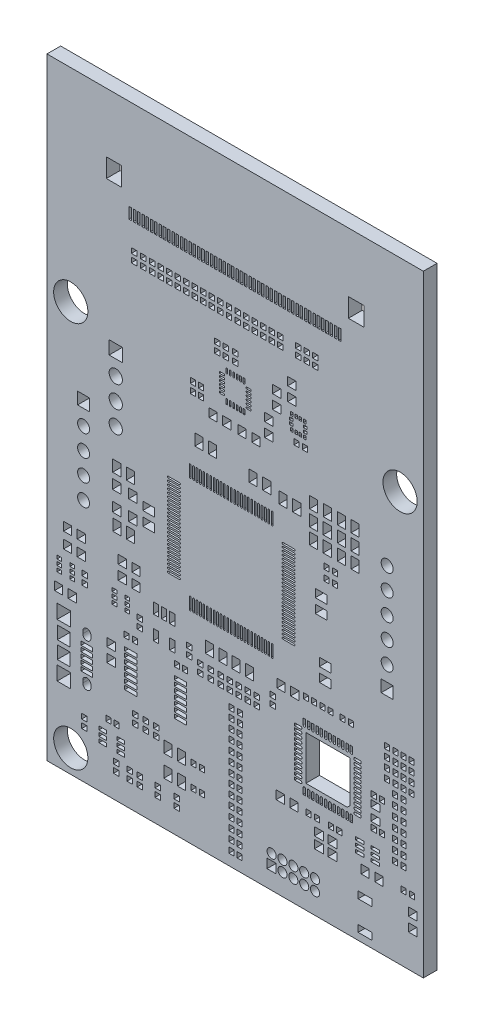
from build123d import *

# Parameters (mm, degrees)
MODEL_W            = 44
MODEL_H            = 71.56
MODEL_R            = 0.775
MODEL_R_2          = 2
MODEL_R_3          = 0.7
MODEL_R_4          = 0.535
MODEL_W_2          = 0.3
MODEL_H_2          = 0.4
MODEL_W_3          = 0.4
MODEL_H_3          = 0.3
MODEL_W_4          = 0.9
MODEL_H_4          = 1.3
MODEL_W_5          = 1.8
MODEL_H_5          = 2.2
MODEL_W_6          = 1.55
MODEL_H_6          = 1.55
MODEL_W_7          = 1.4
MODEL_H_7          = 1.4
MODEL_W_8          = 1
MODEL_H_8          = 1.1
MODEL_W_9          = 0.55
MODEL_W_10         = 1.45
MODEL_H_9          = 0.45
MODEL_W_11         = 0.6
MODEL_H_10         = 1.25
MODEL_H_11         = 1.645
MODEL_W_12         = 1.35
MODEL_W_13         = 1.5
MODEL_H_12         = 1.5
MODEL_H_13         = 0.95
MODEL_W_14         = 0.95
MODEL_H_14         = 1.35
MODEL_W_15         = 1.07
MODEL_H_15         = 1.07
MODEL_W_16         = 0.59
MODEL_H_16         = 0.64
MODEL_W_17         = 0.64
MODEL_H_17         = 0.59
MODEL_W_18         = 1.6
MODEL_H_18         = 0.8
MODEL_H_19         = 1
MODEL_W_19         = 1.05
MODEL_H_20         = 0.35
BOSS_EXTRU_1_DEPTH = 1.6


with BuildPart() as part:
    # Model → Boss.-Extru.1 (new body)
    with BuildSketch(Plane.XY):
        with Locations((51.22, 90.77)):
            Rectangle(MODEL_W, MODEL_H)
        with Locations((37.26, 97.93)):
            Circle(MODEL_R, mode=Mode.SUBTRACT)
        with Locations((37.26, 95.39)):
            Circle(MODEL_R, mode=Mode.SUBTRACT)
        with Locations((37.26, 92.85)):
            Circle(MODEL_R, mode=Mode.SUBTRACT)
        with Locations((32, 57.66)):
            Circle(MODEL_R_2, mode=Mode.SUBTRACT)
        with Locations((32, 102.85)):
            Circle(MODEL_R_2, mode=Mode.SUBTRACT)
        with Locations((70.5, 102.85)):
            Circle(MODEL_R_2, mode=Mode.SUBTRACT)
        with Locations((68.99, 84.61)):
            Circle(MODEL_R_3, mode=Mode.SUBTRACT)
        with Locations((68.99, 87.11)):
            Circle(MODEL_R_3, mode=Mode.SUBTRACT)
        with Locations((68.99, 89.61)):
            Circle(MODEL_R_3, mode=Mode.SUBTRACT)
        with Locations((68.99, 92.11)):
            Circle(MODEL_R_3, mode=Mode.SUBTRACT)
        with Locations((68.99, 94.61)):
            Circle(MODEL_R_3, mode=Mode.SUBTRACT)
        with Locations((33.5, 91)):
            Circle(MODEL_R_3, mode=Mode.SUBTRACT)
        with Locations((33.5, 88.5)):
            Circle(MODEL_R_3, mode=Mode.SUBTRACT)
        with Locations((33.5, 86)):
            Circle(MODEL_R_3, mode=Mode.SUBTRACT)
        with Locations((33.5, 83.5)):
            Circle(MODEL_R_3, mode=Mode.SUBTRACT)
        with Locations((55.48, 58.73)):
            Circle(MODEL_R_4, mode=Mode.SUBTRACT)
        with Locations((56.75, 57.46)):
            Circle(MODEL_R_4, mode=Mode.SUBTRACT)
        with Locations((56.75, 58.73)):
            Circle(MODEL_R_4, mode=Mode.SUBTRACT)
        with Locations((58.02, 57.46)):
            Circle(MODEL_R_4, mode=Mode.SUBTRACT)
        with Locations((58.02, 58.73)):
            Circle(MODEL_R_4, mode=Mode.SUBTRACT)
        with Locations((59.29, 57.46)):
            Circle(MODEL_R_4, mode=Mode.SUBTRACT)
        with Locations((59.29, 58.73)):
            Circle(MODEL_R_4, mode=Mode.SUBTRACT)
        with Locations((60.56, 57.46)):
            Circle(MODEL_R_4, mode=Mode.SUBTRACT)
        with Locations((60.56, 58.73)):
            Circle(MODEL_R_4, mode=Mode.SUBTRACT)
        with BuildLine():
            Line((49.4, 104.5), (49.9, 104.5))
            ThreePointArc((49.9, 104.5), (50, 104.4), (49.9, 104.3))
            Line((49.9, 104.3), (49.4, 104.3))
            Line((49.4, 104.3), (49.4, 104.5))
        make_face(mode=Mode.SUBTRACT)
        with BuildLine():
            Line((49.4, 104.1), (49.9, 104.1))
            ThreePointArc((49.9, 104.1), (50, 104), (49.9, 103.9))
            Line((49.9, 103.9), (49.4, 103.9))
            Line((49.4, 103.9), (49.4, 104.1))
        make_face(mode=Mode.SUBTRACT)
        with BuildLine():
            Line((49.4, 103.7), (49.9, 103.7))
            ThreePointArc((49.9, 103.7), (50, 103.6), (49.9, 103.5))
            Line((49.9, 103.5), (49.4, 103.5))
            Line((49.4, 103.5), (49.4, 103.7))
        make_face(mode=Mode.SUBTRACT)
        with BuildLine():
            Line((49.4, 103.3), (49.9, 103.3))
            ThreePointArc((49.9, 103.3), (50, 103.2), (49.9, 103.1))
            Line((49.9, 103.1), (49.4, 103.1))
            Line((49.4, 103.1), (49.4, 103.3))
        make_face(mode=Mode.SUBTRACT)
        with BuildLine():
            Line((49.4, 102.9), (49.9, 102.9))
            ThreePointArc((49.9, 102.9), (50, 102.8), (49.9, 102.7))
            Line((49.9, 102.7), (49.4, 102.7))
            Line((49.4, 102.7), (49.4, 102.9))
        make_face(mode=Mode.SUBTRACT)
        with BuildLine():
            Line((49.4, 102.5), (49.9, 102.5))
            ThreePointArc((49.9, 102.5), (50, 102.4), (49.9, 102.3))
            Line((49.9, 102.3), (49.4, 102.3))
            Line((49.4, 102.3), (49.4, 102.5))
        make_face(mode=Mode.SUBTRACT)
        with BuildLine():
            Line((50.15, 101.55), (50.15, 102.05))
            ThreePointArc((50.15, 102.05), (50.25, 102.15), (50.35, 102.05))
            Line((50.35, 102.05), (50.35, 101.55))
            Line((50.35, 101.55), (50.15, 101.55))
        make_face(mode=Mode.SUBTRACT)
        with BuildLine():
            Line((50.55, 101.55), (50.55, 102.05))
            ThreePointArc((50.55, 102.05), (50.65, 102.15), (50.75, 102.05))
            Line((50.75, 102.05), (50.75, 101.55))
            Line((50.75, 101.55), (50.55, 101.55))
        make_face(mode=Mode.SUBTRACT)
        with BuildLine():
            Line((50.95, 101.55), (50.95, 102.05))
            ThreePointArc((50.95, 102.05), (51.05, 102.15), (51.15, 102.05))
            Line((51.15, 102.05), (51.15, 101.55))
            Line((51.15, 101.55), (50.95, 101.55))
        make_face(mode=Mode.SUBTRACT)
        with BuildLine():
            Line((51.35, 101.55), (51.35, 102.05))
            ThreePointArc((51.35, 102.05), (51.45, 102.15), (51.55, 102.05))
            Line((51.55, 102.05), (51.55, 101.55))
            Line((51.55, 101.55), (51.35, 101.55))
        make_face(mode=Mode.SUBTRACT)
        with BuildLine():
            Line((51.75, 101.55), (51.75, 102.05))
            ThreePointArc((51.75, 102.05), (51.85, 102.15), (51.95, 102.05))
            Line((51.95, 102.05), (51.95, 101.55))
            Line((51.95, 101.55), (51.75, 101.55))
        make_face(mode=Mode.SUBTRACT)
        with BuildLine():
            Line((52.15, 101.55), (52.15, 102.05))
            ThreePointArc((52.15, 102.05), (52.25, 102.15), (52.35, 102.05))
            Line((52.35, 102.05), (52.35, 101.55))
            Line((52.35, 101.55), (52.15, 101.55))
        make_face(mode=Mode.SUBTRACT)
        with BuildLine():
            Line((53.1, 102.3), (52.6, 102.3))
            ThreePointArc((52.6, 102.3), (52.5, 102.4), (52.6, 102.5))
            Line((52.6, 102.5), (53.1, 102.5))
            Line((53.1, 102.5), (53.1, 102.3))
        make_face(mode=Mode.SUBTRACT)
        with BuildLine():
            Line((53.1, 102.7), (52.6, 102.7))
            ThreePointArc((52.6, 102.7), (52.5, 102.8), (52.6, 102.9))
            Line((52.6, 102.9), (53.1, 102.9))
            Line((53.1, 102.9), (53.1, 102.7))
        make_face(mode=Mode.SUBTRACT)
        with BuildLine():
            Line((53.1, 103.1), (52.6, 103.1))
            ThreePointArc((52.6, 103.1), (52.5, 103.2), (52.6, 103.3))
            Line((52.6, 103.3), (53.1, 103.3))
            Line((53.1, 103.3), (53.1, 103.1))
        make_face(mode=Mode.SUBTRACT)
        with BuildLine():
            Line((53.1, 103.5), (52.6, 103.5))
            ThreePointArc((52.6, 103.5), (52.5, 103.6), (52.6, 103.7))
            Line((52.6, 103.7), (53.1, 103.7))
            Line((53.1, 103.7), (53.1, 103.5))
        make_face(mode=Mode.SUBTRACT)
        with BuildLine():
            Line((53.1, 103.9), (52.6, 103.9))
            ThreePointArc((52.6, 103.9), (52.5, 104), (52.6, 104.1))
            Line((52.6, 104.1), (53.1, 104.1))
            Line((53.1, 104.1), (53.1, 103.9))
        make_face(mode=Mode.SUBTRACT)
        with BuildLine():
            Line((53.1, 104.3), (52.6, 104.3))
            ThreePointArc((52.6, 104.3), (52.5, 104.4), (52.6, 104.5))
            Line((52.6, 104.5), (53.1, 104.5))
            Line((53.1, 104.5), (53.1, 104.3))
        make_face(mode=Mode.SUBTRACT)
        with BuildLine():
            Line((52.35, 105.25), (52.35, 104.75))
            ThreePointArc((52.35, 104.75), (52.25, 104.65), (52.15, 104.75))
            Line((52.15, 104.75), (52.15, 105.25))
            Line((52.15, 105.25), (52.35, 105.25))
        make_face(mode=Mode.SUBTRACT)
        with BuildLine():
            Line((51.95, 105.25), (51.95, 104.75))
            ThreePointArc((51.95, 104.75), (51.85, 104.65), (51.75, 104.75))
            Line((51.75, 104.75), (51.75, 105.25))
            Line((51.75, 105.25), (51.95, 105.25))
        make_face(mode=Mode.SUBTRACT)
        with BuildLine():
            Line((51.55, 105.25), (51.55, 104.75))
            ThreePointArc((51.55, 104.75), (51.45, 104.65), (51.35, 104.75))
            Line((51.35, 104.75), (51.35, 105.25))
            Line((51.35, 105.25), (51.55, 105.25))
        make_face(mode=Mode.SUBTRACT)
        with BuildLine():
            Line((51.15, 105.25), (51.15, 104.75))
            ThreePointArc((51.15, 104.75), (51.05, 104.65), (50.95, 104.75))
            Line((50.95, 104.75), (50.95, 105.25))
            Line((50.95, 105.25), (51.15, 105.25))
        make_face(mode=Mode.SUBTRACT)
        with BuildLine():
            Line((50.75, 105.25), (50.75, 104.75))
            ThreePointArc((50.75, 104.75), (50.65, 104.65), (50.55, 104.75))
            Line((50.55, 104.75), (50.55, 105.25))
            Line((50.55, 105.25), (50.75, 105.25))
        make_face(mode=Mode.SUBTRACT)
        with BuildLine():
            Line((50.35, 105.25), (50.35, 104.75))
            ThreePointArc((50.35, 104.75), (50.25, 104.65), (50.15, 104.75))
            Line((50.15, 104.75), (50.15, 105.25))
            Line((50.15, 105.25), (50.35, 105.25))
        make_face(mode=Mode.SUBTRACT)
        with Locations((59.35, 104.4)):
            Rectangle(MODEL_W_2, MODEL_H_2, mode=Mode.SUBTRACT)
        with Locations((58.85, 104.4)):
            Rectangle(MODEL_W_2, MODEL_H_2, mode=Mode.SUBTRACT)
        with Locations((58.35, 104.4)):
            Rectangle(MODEL_W_2, MODEL_H_2, mode=Mode.SUBTRACT)
        with Locations((57.85, 104.4)):
            Rectangle(MODEL_W_2, MODEL_H_2, mode=Mode.SUBTRACT)
        with Locations((57.8, 103.85)):
            Rectangle(MODEL_W_3, MODEL_H_3, mode=Mode.SUBTRACT)
        with Locations((57.8, 103.35)):
            Rectangle(MODEL_W_3, MODEL_H_3, mode=Mode.SUBTRACT)
        with Locations((57.85, 102.8)):
            Rectangle(MODEL_W_2, MODEL_H_2, mode=Mode.SUBTRACT)
        with Locations((58.35, 102.8)):
            Rectangle(MODEL_W_2, MODEL_H_2, mode=Mode.SUBTRACT)
        with Locations((58.85, 102.8)):
            Rectangle(MODEL_W_2, MODEL_H_2, mode=Mode.SUBTRACT)
        with Locations((59.35, 102.8)):
            Rectangle(MODEL_W_2, MODEL_H_2, mode=Mode.SUBTRACT)
        with Locations((59.4, 103.35)):
            Rectangle(MODEL_W_3, MODEL_H_3, mode=Mode.SUBTRACT)
        with Locations((59.4, 103.85)):
            Rectangle(MODEL_W_3, MODEL_H_3, mode=Mode.SUBTRACT)
        with Locations((35.75, 61.35)):
            Rectangle(MODEL_W_4, MODEL_H_2, mode=Mode.SUBTRACT)
        with Locations((35.75, 60.7)):
            Rectangle(MODEL_W_4, MODEL_H_2, mode=Mode.SUBTRACT)
        with Locations((35.75, 60.05)):
            Rectangle(MODEL_W_4, MODEL_H_2, mode=Mode.SUBTRACT)
        with Locations((37.85, 60.05)):
            Rectangle(MODEL_W_4, MODEL_H_2, mode=Mode.SUBTRACT)
        with Locations((37.85, 60.7)):
            Rectangle(MODEL_W_4, MODEL_H_2, mode=Mode.SUBTRACT)
        with Locations((37.85, 61.35)):
            Rectangle(MODEL_W_4, MODEL_H_2, mode=Mode.SUBTRACT)
        with Locations((38.9605, 115.2542)):
            Rectangle(MODEL_W_2, MODEL_H_4, mode=Mode.SUBTRACT)
        with Locations((39.4605, 115.2542)):
            Rectangle(MODEL_W_2, MODEL_H_4, mode=Mode.SUBTRACT)
        with Locations((39.9605, 115.2542)):
            Rectangle(MODEL_W_2, MODEL_H_4, mode=Mode.SUBTRACT)
        with Locations((40.4605, 115.2542)):
            Rectangle(MODEL_W_2, MODEL_H_4, mode=Mode.SUBTRACT)
        with Locations((40.9605, 115.2542)):
            Rectangle(MODEL_W_2, MODEL_H_4, mode=Mode.SUBTRACT)
        with Locations((41.4605, 115.2542)):
            Rectangle(MODEL_W_2, MODEL_H_4, mode=Mode.SUBTRACT)
        with Locations((41.9605, 115.2542)):
            Rectangle(MODEL_W_2, MODEL_H_4, mode=Mode.SUBTRACT)
        with Locations((42.4605, 115.2542)):
            Rectangle(MODEL_W_2, MODEL_H_4, mode=Mode.SUBTRACT)
        with Locations((42.9605, 115.2542)):
            Rectangle(MODEL_W_2, MODEL_H_4, mode=Mode.SUBTRACT)
        with Locations((43.4605, 115.2542)):
            Rectangle(MODEL_W_2, MODEL_H_4, mode=Mode.SUBTRACT)
        with Locations((43.9605, 115.2542)):
            Rectangle(MODEL_W_2, MODEL_H_4, mode=Mode.SUBTRACT)
        with Locations((44.4605, 115.2542)):
            Rectangle(MODEL_W_2, MODEL_H_4, mode=Mode.SUBTRACT)
        with Locations((44.9605, 115.2542)):
            Rectangle(MODEL_W_2, MODEL_H_4, mode=Mode.SUBTRACT)
        with Locations((45.4605, 115.2542)):
            Rectangle(MODEL_W_2, MODEL_H_4, mode=Mode.SUBTRACT)
        with Locations((45.9605, 115.2542)):
            Rectangle(MODEL_W_2, MODEL_H_4, mode=Mode.SUBTRACT)
        with Locations((46.4605, 115.2542)):
            Rectangle(MODEL_W_2, MODEL_H_4, mode=Mode.SUBTRACT)
        with Locations((46.9605, 115.2542)):
            Rectangle(MODEL_W_2, MODEL_H_4, mode=Mode.SUBTRACT)
        with Locations((47.4605, 115.2542)):
            Rectangle(MODEL_W_2, MODEL_H_4, mode=Mode.SUBTRACT)
        with Locations((47.9605, 115.2542)):
            Rectangle(MODEL_W_2, MODEL_H_4, mode=Mode.SUBTRACT)
        with Locations((48.4605, 115.2542)):
            Rectangle(MODEL_W_2, MODEL_H_4, mode=Mode.SUBTRACT)
        with Locations((48.9605, 115.2542)):
            Rectangle(MODEL_W_2, MODEL_H_4, mode=Mode.SUBTRACT)
        with Locations((49.4605, 115.2542)):
            Rectangle(MODEL_W_2, MODEL_H_4, mode=Mode.SUBTRACT)
        with Locations((49.9605, 115.2542)):
            Rectangle(MODEL_W_2, MODEL_H_4, mode=Mode.SUBTRACT)
        with Locations((50.4605, 115.2542)):
            Rectangle(MODEL_W_2, MODEL_H_4, mode=Mode.SUBTRACT)
        with Locations((50.9605, 115.2542)):
            Rectangle(MODEL_W_2, MODEL_H_4, mode=Mode.SUBTRACT)
        with Locations((51.4605, 115.2542)):
            Rectangle(MODEL_W_2, MODEL_H_4, mode=Mode.SUBTRACT)
        with Locations((51.9605, 115.2542)):
            Rectangle(MODEL_W_2, MODEL_H_4, mode=Mode.SUBTRACT)
        with Locations((52.4605, 115.2542)):
            Rectangle(MODEL_W_2, MODEL_H_4, mode=Mode.SUBTRACT)
        with Locations((52.9605, 115.2542)):
            Rectangle(MODEL_W_2, MODEL_H_4, mode=Mode.SUBTRACT)
        with Locations((53.4605, 115.2542)):
            Rectangle(MODEL_W_2, MODEL_H_4, mode=Mode.SUBTRACT)
        with Locations((53.9605, 115.2542)):
            Rectangle(MODEL_W_2, MODEL_H_4, mode=Mode.SUBTRACT)
        with Locations((54.4605, 115.2542)):
            Rectangle(MODEL_W_2, MODEL_H_4, mode=Mode.SUBTRACT)
        with Locations((54.9605, 115.2542)):
            Rectangle(MODEL_W_2, MODEL_H_4, mode=Mode.SUBTRACT)
        with Locations((55.4605, 115.2542)):
            Rectangle(MODEL_W_2, MODEL_H_4, mode=Mode.SUBTRACT)
        with Locations((55.9605, 115.2542)):
            Rectangle(MODEL_W_2, MODEL_H_4, mode=Mode.SUBTRACT)
        with Locations((56.4605, 115.2542)):
            Rectangle(MODEL_W_2, MODEL_H_4, mode=Mode.SUBTRACT)
        with Locations((56.9605, 115.2542)):
            Rectangle(MODEL_W_2, MODEL_H_4, mode=Mode.SUBTRACT)
        with Locations((57.4605, 115.2542)):
            Rectangle(MODEL_W_2, MODEL_H_4, mode=Mode.SUBTRACT)
        with Locations((57.9605, 115.2542)):
            Rectangle(MODEL_W_2, MODEL_H_4, mode=Mode.SUBTRACT)
        with Locations((58.4605, 115.2542)):
            Rectangle(MODEL_W_2, MODEL_H_4, mode=Mode.SUBTRACT)
        with Locations((58.9605, 115.2542)):
            Rectangle(MODEL_W_2, MODEL_H_4, mode=Mode.SUBTRACT)
        with Locations((59.4605, 115.2542)):
            Rectangle(MODEL_W_2, MODEL_H_4, mode=Mode.SUBTRACT)
        with Locations((59.9605, 115.2542)):
            Rectangle(MODEL_W_2, MODEL_H_4, mode=Mode.SUBTRACT)
        with Locations((60.4605, 115.2542)):
            Rectangle(MODEL_W_2, MODEL_H_4, mode=Mode.SUBTRACT)
        with Locations((60.9605, 115.2542)):
            Rectangle(MODEL_W_2, MODEL_H_4, mode=Mode.SUBTRACT)
        with Locations((61.4605, 115.2542)):
            Rectangle(MODEL_W_2, MODEL_H_4, mode=Mode.SUBTRACT)
        with Locations((61.9605, 115.2542)):
            Rectangle(MODEL_W_2, MODEL_H_4, mode=Mode.SUBTRACT)
        with Locations((62.4605, 115.2542)):
            Rectangle(MODEL_W_2, MODEL_H_4, mode=Mode.SUBTRACT)
        with Locations((62.9605, 115.2542)):
            Rectangle(MODEL_W_2, MODEL_H_4, mode=Mode.SUBTRACT)
        with Locations((63.4605, 115.2542)):
            Rectangle(MODEL_W_2, MODEL_H_4, mode=Mode.SUBTRACT)
        with Locations((37.0605, 118.5042)):
            Rectangle(MODEL_W_5, MODEL_H_5, mode=Mode.SUBTRACT)
        with Locations((65.3605, 118.5042)):
            Rectangle(MODEL_W_5, MODEL_H_5, mode=Mode.SUBTRACT)
        with Locations((37.26, 100.47)):
            Rectangle(MODEL_W_6, MODEL_H_6, mode=Mode.SUBTRACT)
        with Locations((68.99, 82.11)):
            Rectangle(MODEL_W_7, MODEL_H_7, mode=Mode.SUBTRACT)
        with Locations((39.27, 86.84)):
            Rectangle(MODEL_W_8, MODEL_H_8, mode=Mode.SUBTRACT)
        with Locations((37.37, 86.84)):
            Rectangle(MODEL_W_8, MODEL_H_8, mode=Mode.SUBTRACT)
        with Locations((37.37, 84.54)):
            Rectangle(MODEL_W_8, MODEL_H_8, mode=Mode.SUBTRACT)
        with Locations((39.27, 84.54)):
            Rectangle(MODEL_W_8, MODEL_H_8, mode=Mode.SUBTRACT)
        with Locations((37.12, 76.14)):
            Rectangle(MODEL_W_9, MODEL_H_2, mode=Mode.SUBTRACT)
        with Locations((37.12, 75.49)):
            Rectangle(MODEL_W_9, MODEL_H_2, mode=Mode.SUBTRACT)
        with Locations((37.12, 74.84)):
            Rectangle(MODEL_W_9, MODEL_H_2, mode=Mode.SUBTRACT)
        with Locations((38.62, 74.84)):
            Rectangle(MODEL_W_9, MODEL_H_2, mode=Mode.SUBTRACT)
        with Locations((38.62, 75.49)):
            Rectangle(MODEL_W_9, MODEL_H_2, mode=Mode.SUBTRACT)
        with Locations((38.62, 76.14)):
            Rectangle(MODEL_W_9, MODEL_H_2, mode=Mode.SUBTRACT)
        with Locations((30.67, 76.2)):
            Rectangle(MODEL_W_9, MODEL_H_2, mode=Mode.SUBTRACT)
        with Locations((30.67, 75.55)):
            Rectangle(MODEL_W_9, MODEL_H_2, mode=Mode.SUBTRACT)
        with Locations((30.67, 74.9)):
            Rectangle(MODEL_W_9, MODEL_H_2, mode=Mode.SUBTRACT)
        with Locations((32.17, 74.9)):
            Rectangle(MODEL_W_9, MODEL_H_2, mode=Mode.SUBTRACT)
        with Locations((32.17, 75.55)):
            Rectangle(MODEL_W_9, MODEL_H_2, mode=Mode.SUBTRACT)
        with Locations((32.17, 76.2)):
            Rectangle(MODEL_W_9, MODEL_H_2, mode=Mode.SUBTRACT)
        with Locations((44.83, 66.95)):
            Rectangle(MODEL_W_10, MODEL_H_9, mode=Mode.SUBTRACT)
        with Locations((44.83, 67.6)):
            Rectangle(MODEL_W_10, MODEL_H_9, mode=Mode.SUBTRACT)
        with Locations((44.83, 68.25)):
            Rectangle(MODEL_W_10, MODEL_H_9, mode=Mode.SUBTRACT)
        with Locations((44.83, 68.9)):
            Rectangle(MODEL_W_10, MODEL_H_9, mode=Mode.SUBTRACT)
        with Locations((44.83, 69.55)):
            Rectangle(MODEL_W_10, MODEL_H_9, mode=Mode.SUBTRACT)
        with Locations((44.83, 70.2)):
            Rectangle(MODEL_W_10, MODEL_H_9, mode=Mode.SUBTRACT)
        with Locations((44.83, 70.85)):
            Rectangle(MODEL_W_10, MODEL_H_9, mode=Mode.SUBTRACT)
        with Locations((39.03, 70.85)):
            Rectangle(MODEL_W_10, MODEL_H_9, mode=Mode.SUBTRACT)
        with Locations((39.03, 70.2)):
            Rectangle(MODEL_W_10, MODEL_H_9, mode=Mode.SUBTRACT)
        with Locations((39.03, 69.55)):
            Rectangle(MODEL_W_10, MODEL_H_9, mode=Mode.SUBTRACT)
        with Locations((39.03, 68.9)):
            Rectangle(MODEL_W_10, MODEL_H_9, mode=Mode.SUBTRACT)
        with Locations((39.03, 68.25)):
            Rectangle(MODEL_W_10, MODEL_H_9, mode=Mode.SUBTRACT)
        with Locations((39.03, 67.6)):
            Rectangle(MODEL_W_10, MODEL_H_9, mode=Mode.SUBTRACT)
        with Locations((39.03, 66.95)):
            Rectangle(MODEL_W_10, MODEL_H_9, mode=Mode.SUBTRACT)
        with Locations((43.86, 76.68)):
            Rectangle(MODEL_W_11, MODEL_H_10, mode=Mode.SUBTRACT)
        with Locations((42.91, 76.68)):
            Rectangle(MODEL_W_11, MODEL_H_10, mode=Mode.SUBTRACT)
        with Locations((41.96, 76.68)):
            Rectangle(MODEL_W_11, MODEL_H_10, mode=Mode.SUBTRACT)
        with Locations((41.96, 73.98)):
            Rectangle(MODEL_W_11, MODEL_H_10, mode=Mode.SUBTRACT)
        with Locations((43.86, 73.98)):
            Rectangle(MODEL_W_11, MODEL_H_10, mode=Mode.SUBTRACT)
        with Locations((31.18, 64.468)):
            Rectangle(MODEL_W_6, MODEL_H_11, mode=Mode.SUBTRACT)
        with Locations((31.18, 70.712)):
            Rectangle(MODEL_W_6, MODEL_H_11, mode=Mode.SUBTRACT)
        with BuildLine():
            Line((34.355, 65.24), (34.355, 64.94))
            ThreePointArc((34.355, 64.94), (33.88, 64.465), (33.405, 64.94))
            Line((33.405, 64.94), (33.405, 65.24))
            ThreePointArc((33.405, 65.24), (33.88, 65.715), (34.355, 65.24))
        make_face(mode=Mode.SUBTRACT)
        with BuildLine():
            Line((34.355, 70.24), (34.355, 69.94))
            ThreePointArc((34.355, 69.94), (33.88, 69.465), (33.405, 69.94))
            Line((33.405, 69.94), (33.405, 70.24))
            ThreePointArc((33.405, 70.24), (33.88, 70.715), (34.355, 70.24))
        make_face(mode=Mode.SUBTRACT)
        with Locations((33.88, 66.29)):
            Rectangle(MODEL_W_12, MODEL_H_9, mode=Mode.SUBTRACT)
        with Locations((33.88, 66.94)):
            Rectangle(MODEL_W_12, MODEL_H_9, mode=Mode.SUBTRACT)
        with Locations((33.88, 67.59)):
            Rectangle(MODEL_W_12, MODEL_H_9, mode=Mode.SUBTRACT)
        with Locations((33.88, 68.24)):
            Rectangle(MODEL_W_12, MODEL_H_9, mode=Mode.SUBTRACT)
        with Locations((33.88, 68.89)):
            Rectangle(MODEL_W_12, MODEL_H_9, mode=Mode.SUBTRACT)
        with Locations((31.18, 66.59)):
            Rectangle(MODEL_W_13, MODEL_H_12, mode=Mode.SUBTRACT)
        with Locations((31.18, 68.59)):
            Rectangle(MODEL_W_13, MODEL_H_12, mode=Mode.SUBTRACT)
        with Locations((61.74, 80.92)):
            Rectangle(MODEL_W_12, MODEL_H_13, mode=Mode.SUBTRACT)
        with Locations((61.74, 79.32)):
            Rectangle(MODEL_W_12, MODEL_H_13, mode=Mode.SUBTRACT)
        with Locations((41.1, 86.4)):
            Rectangle(MODEL_W_12, MODEL_H_13, mode=Mode.SUBTRACT)
        with Locations((41.1, 84.8)):
            Rectangle(MODEL_W_12, MODEL_H_13, mode=Mode.SUBTRACT)
        with Locations((58.42, 95.22)):
            Rectangle(MODEL_W_14, MODEL_H_14, mode=Mode.SUBTRACT)
        with Locations((56.82, 95.22)):
            Rectangle(MODEL_W_14, MODEL_H_14, mode=Mode.SUBTRACT)
        with Locations((53.32, 95.67)):
            Rectangle(MODEL_W_14, MODEL_H_14, mode=Mode.SUBTRACT)
        with Locations((54.92, 95.67)):
            Rectangle(MODEL_W_14, MODEL_H_14, mode=Mode.SUBTRACT)
        with Locations((46.98, 96.16)):
            Rectangle(MODEL_W_14, MODEL_H_14, mode=Mode.SUBTRACT)
        with Locations((48.58, 96.16)):
            Rectangle(MODEL_W_14, MODEL_H_14, mode=Mode.SUBTRACT)
        with Locations((61.26, 87.65)):
            Rectangle(MODEL_W_12, MODEL_H_13, mode=Mode.SUBTRACT)
        with Locations((61.26, 86.05)):
            Rectangle(MODEL_W_12, MODEL_H_13, mode=Mode.SUBTRACT)
        with Locations((48.2, 75.8)):
            Rectangle(MODEL_W_14, MODEL_H_14, mode=Mode.SUBTRACT)
        with Locations((49.8, 75.8)):
            Rectangle(MODEL_W_14, MODEL_H_14, mode=Mode.SUBTRACT)
        with Locations((52.9, 75.8)):
            Rectangle(MODEL_W_14, MODEL_H_14, mode=Mode.SUBTRACT)
        with Locations((51.3, 75.8)):
            Rectangle(MODEL_W_14, MODEL_H_14, mode=Mode.SUBTRACT)
        with Locations((37.39, 82.74)):
            Rectangle(MODEL_W_14, MODEL_H_14, mode=Mode.SUBTRACT)
        with Locations((38.99, 82.74)):
            Rectangle(MODEL_W_14, MODEL_H_14, mode=Mode.SUBTRACT)
        with Locations((38.97, 88.71)):
            Rectangle(MODEL_W_14, MODEL_H_14, mode=Mode.SUBTRACT)
        with Locations((37.37, 88.71)):
            Rectangle(MODEL_W_14, MODEL_H_14, mode=Mode.SUBTRACT)
        with Locations((63.65, 96.52)):
            Rectangle(MODEL_W_14, MODEL_H_14, mode=Mode.SUBTRACT)
        with Locations((65.25, 96.52)):
            Rectangle(MODEL_W_14, MODEL_H_14, mode=Mode.SUBTRACT)
        with Locations((63.65, 94.68)):
            Rectangle(MODEL_W_14, MODEL_H_14, mode=Mode.SUBTRACT)
        with Locations((65.25, 94.68)):
            Rectangle(MODEL_W_14, MODEL_H_14, mode=Mode.SUBTRACT)
        with Locations((63.65, 92.85)):
            Rectangle(MODEL_W_14, MODEL_H_14, mode=Mode.SUBTRACT)
        with Locations((65.25, 92.85)):
            Rectangle(MODEL_W_14, MODEL_H_14, mode=Mode.SUBTRACT)
        with Locations((62, 96.52)):
            Rectangle(MODEL_W_14, MODEL_H_14, mode=Mode.SUBTRACT)
        with Locations((60.4, 96.52)):
            Rectangle(MODEL_W_14, MODEL_H_14, mode=Mode.SUBTRACT)
        with Locations((61.99, 94.68)):
            Rectangle(MODEL_W_14, MODEL_H_14, mode=Mode.SUBTRACT)
        with Locations((60.39, 94.68)):
            Rectangle(MODEL_W_14, MODEL_H_14, mode=Mode.SUBTRACT)
        with Locations((61.98, 92.84)):
            Rectangle(MODEL_W_14, MODEL_H_14, mode=Mode.SUBTRACT)
        with Locations((60.38, 92.84)):
            Rectangle(MODEL_W_14, MODEL_H_14, mode=Mode.SUBTRACT)
        with Locations((33.5, 93.5)):
            Rectangle(MODEL_W_7, MODEL_H_7, mode=Mode.SUBTRACT)
        with BuildLine():
            Line((56.81, 81.28), (58.11, 81.28))
            ThreePointArc((58.11, 81.28), (58.21, 81.18), (58.11, 81.08))
            Line((58.11, 81.08), (56.81, 81.08))
            ThreePointArc((56.81, 81.08), (56.71, 81.18), (56.81, 81.28))
        make_face(mode=Mode.SUBTRACT)
        with BuildLine():
            Line((56.81, 81.68), (58.11, 81.68))
            ThreePointArc((58.11, 81.68), (58.21, 81.58), (58.11, 81.48))
            Line((58.11, 81.48), (56.81, 81.48))
            ThreePointArc((56.81, 81.48), (56.71, 81.58), (56.81, 81.68))
        make_face(mode=Mode.SUBTRACT)
        with BuildLine():
            Line((56.81, 82.08), (58.11, 82.08))
            ThreePointArc((58.11, 82.08), (58.21, 81.98), (58.11, 81.88))
            Line((58.11, 81.88), (56.81, 81.88))
            ThreePointArc((56.81, 81.88), (56.71, 81.98), (56.81, 82.08))
        make_face(mode=Mode.SUBTRACT)
        with BuildLine():
            Line((56.81, 82.48), (58.11, 82.48))
            ThreePointArc((58.11, 82.48), (58.21, 82.38), (58.11, 82.28))
            Line((58.11, 82.28), (56.81, 82.28))
            ThreePointArc((56.81, 82.28), (56.71, 82.38), (56.81, 82.48))
        make_face(mode=Mode.SUBTRACT)
        with BuildLine():
            Line((56.81, 82.88), (58.11, 82.88))
            ThreePointArc((58.11, 82.88), (58.21, 82.78), (58.11, 82.68))
            Line((58.11, 82.68), (56.81, 82.68))
            ThreePointArc((56.81, 82.68), (56.71, 82.78), (56.81, 82.88))
        make_face(mode=Mode.SUBTRACT)
        with BuildLine():
            Line((56.81, 83.28), (58.11, 83.28))
            ThreePointArc((58.11, 83.28), (58.21, 83.18), (58.11, 83.08))
            Line((58.11, 83.08), (56.81, 83.08))
            ThreePointArc((56.81, 83.08), (56.71, 83.18), (56.81, 83.28))
        make_face(mode=Mode.SUBTRACT)
        with BuildLine():
            Line((56.81, 83.68), (58.11, 83.68))
            ThreePointArc((58.11, 83.68), (58.21, 83.58), (58.11, 83.48))
            Line((58.11, 83.48), (56.81, 83.48))
            ThreePointArc((56.81, 83.48), (56.71, 83.58), (56.81, 83.68))
        make_face(mode=Mode.SUBTRACT)
        with BuildLine():
            Line((56.81, 84.08), (58.11, 84.08))
            ThreePointArc((58.11, 84.08), (58.21, 83.98), (58.11, 83.88))
            Line((58.11, 83.88), (56.81, 83.88))
            ThreePointArc((56.81, 83.88), (56.71, 83.98), (56.81, 84.08))
        make_face(mode=Mode.SUBTRACT)
        with BuildLine():
            Line((56.81, 84.48), (58.11, 84.48))
            ThreePointArc((58.11, 84.48), (58.21, 84.38), (58.11, 84.28))
            Line((58.11, 84.28), (56.81, 84.28))
            ThreePointArc((56.81, 84.28), (56.71, 84.38), (56.81, 84.48))
        make_face(mode=Mode.SUBTRACT)
        with BuildLine():
            Line((56.81, 84.88), (58.11, 84.88))
            ThreePointArc((58.11, 84.88), (58.21, 84.78), (58.11, 84.68))
            Line((58.11, 84.68), (56.81, 84.68))
            ThreePointArc((56.81, 84.68), (56.71, 84.78), (56.81, 84.88))
        make_face(mode=Mode.SUBTRACT)
        with BuildLine():
            Line((56.81, 85.28), (58.11, 85.28))
            ThreePointArc((58.11, 85.28), (58.21, 85.18), (58.11, 85.08))
            Line((58.11, 85.08), (56.81, 85.08))
            ThreePointArc((56.81, 85.08), (56.71, 85.18), (56.81, 85.28))
        make_face(mode=Mode.SUBTRACT)
        with BuildLine():
            Line((56.81, 85.68), (58.11, 85.68))
            ThreePointArc((58.11, 85.68), (58.21, 85.58), (58.11, 85.48))
            Line((58.11, 85.48), (56.81, 85.48))
            ThreePointArc((56.81, 85.48), (56.71, 85.58), (56.81, 85.68))
        make_face(mode=Mode.SUBTRACT)
        with BuildLine():
            Line((56.81, 86.08), (58.11, 86.08))
            ThreePointArc((58.11, 86.08), (58.21, 85.98), (58.11, 85.88))
            Line((58.11, 85.88), (56.81, 85.88))
            ThreePointArc((56.81, 85.88), (56.71, 85.98), (56.81, 86.08))
        make_face(mode=Mode.SUBTRACT)
        with BuildLine():
            Line((56.81, 86.48), (58.11, 86.48))
            ThreePointArc((58.11, 86.48), (58.21, 86.38), (58.11, 86.28))
            Line((58.11, 86.28), (56.81, 86.28))
            ThreePointArc((56.81, 86.28), (56.71, 86.38), (56.81, 86.48))
        make_face(mode=Mode.SUBTRACT)
        with BuildLine():
            Line((56.81, 86.88), (58.11, 86.88))
            ThreePointArc((58.11, 86.88), (58.21, 86.78), (58.11, 86.68))
            Line((58.11, 86.68), (56.81, 86.68))
            ThreePointArc((56.81, 86.68), (56.71, 86.78), (56.81, 86.88))
        make_face(mode=Mode.SUBTRACT)
        with BuildLine():
            Line((56.81, 87.28), (58.11, 87.28))
            ThreePointArc((58.11, 87.28), (58.21, 87.18), (58.11, 87.08))
            Line((58.11, 87.08), (56.81, 87.08))
            ThreePointArc((56.81, 87.08), (56.71, 87.18), (56.81, 87.28))
        make_face(mode=Mode.SUBTRACT)
        with BuildLine():
            Line((56.81, 87.68), (58.11, 87.68))
            ThreePointArc((58.11, 87.68), (58.21, 87.58), (58.11, 87.48))
            Line((58.11, 87.48), (56.81, 87.48))
            ThreePointArc((56.81, 87.48), (56.71, 87.58), (56.81, 87.68))
        make_face(mode=Mode.SUBTRACT)
        with BuildLine():
            Line((56.81, 88.08), (58.11, 88.08))
            ThreePointArc((58.11, 88.08), (58.21, 87.98), (58.11, 87.88))
            Line((58.11, 87.88), (56.81, 87.88))
            ThreePointArc((56.81, 87.88), (56.71, 87.98), (56.81, 88.08))
        make_face(mode=Mode.SUBTRACT)
        with BuildLine():
            Line((56.81, 88.48), (58.11, 88.48))
            ThreePointArc((58.11, 88.48), (58.21, 88.38), (58.11, 88.28))
            Line((58.11, 88.28), (56.81, 88.28))
            ThreePointArc((56.81, 88.28), (56.71, 88.38), (56.81, 88.48))
        make_face(mode=Mode.SUBTRACT)
        with BuildLine():
            Line((56.81, 88.88), (58.11, 88.88))
            ThreePointArc((58.11, 88.88), (58.21, 88.78), (58.11, 88.68))
            Line((58.11, 88.68), (56.81, 88.68))
            ThreePointArc((56.81, 88.68), (56.71, 88.78), (56.81, 88.88))
        make_face(mode=Mode.SUBTRACT)
        with BuildLine():
            Line((56.81, 89.28), (58.11, 89.28))
            ThreePointArc((58.11, 89.28), (58.21, 89.18), (58.11, 89.08))
            Line((58.11, 89.08), (56.81, 89.08))
            ThreePointArc((56.81, 89.08), (56.71, 89.18), (56.81, 89.28))
        make_face(mode=Mode.SUBTRACT)
        with BuildLine():
            Line((56.81, 89.68), (58.11, 89.68))
            ThreePointArc((58.11, 89.68), (58.21, 89.58), (58.11, 89.48))
            Line((58.11, 89.48), (56.81, 89.48))
            ThreePointArc((56.81, 89.48), (56.71, 89.58), (56.81, 89.68))
        make_face(mode=Mode.SUBTRACT)
        with BuildLine():
            Line((56.81, 90.08), (58.11, 90.08))
            ThreePointArc((58.11, 90.08), (58.21, 89.98), (58.11, 89.88))
            Line((58.11, 89.88), (56.81, 89.88))
            ThreePointArc((56.81, 89.88), (56.71, 89.98), (56.81, 90.08))
        make_face(mode=Mode.SUBTRACT)
        with BuildLine():
            Line((56.81, 90.48), (58.11, 90.48))
            ThreePointArc((58.11, 90.48), (58.21, 90.38), (58.11, 90.28))
            Line((58.11, 90.28), (56.81, 90.28))
            ThreePointArc((56.81, 90.28), (56.71, 90.38), (56.81, 90.48))
        make_face(mode=Mode.SUBTRACT)
        with BuildLine():
            Line((56.81, 90.88), (58.11, 90.88))
            ThreePointArc((58.11, 90.88), (58.21, 90.78), (58.11, 90.68))
            Line((58.11, 90.68), (56.81, 90.68))
            ThreePointArc((56.81, 90.68), (56.71, 90.78), (56.81, 90.88))
        make_face(mode=Mode.SUBTRACT)
        with BuildLine():
            Line((55.46, 92.03), (55.46, 93.33))
            ThreePointArc((55.46, 93.33), (55.56, 93.43), (55.66, 93.33))
            Line((55.66, 93.33), (55.66, 92.03))
            ThreePointArc((55.66, 92.03), (55.56, 91.93), (55.46, 92.03))
        make_face(mode=Mode.SUBTRACT)
        with BuildLine():
            Line((55.06, 92.03), (55.06, 93.33))
            ThreePointArc((55.06, 93.33), (55.16, 93.43), (55.26, 93.33))
            Line((55.26, 93.33), (55.26, 92.03))
            ThreePointArc((55.26, 92.03), (55.16, 91.93), (55.06, 92.03))
        make_face(mode=Mode.SUBTRACT)
        with BuildLine():
            Line((54.66, 92.03), (54.66, 93.33))
            ThreePointArc((54.66, 93.33), (54.76, 93.43), (54.86, 93.33))
            Line((54.86, 93.33), (54.86, 92.03))
            ThreePointArc((54.86, 92.03), (54.76, 91.93), (54.66, 92.03))
        make_face(mode=Mode.SUBTRACT)
        with BuildLine():
            Line((54.26, 92.03), (54.26, 93.33))
            ThreePointArc((54.26, 93.33), (54.36, 93.43), (54.46, 93.33))
            Line((54.46, 93.33), (54.46, 92.03))
            ThreePointArc((54.46, 92.03), (54.36, 91.93), (54.26, 92.03))
        make_face(mode=Mode.SUBTRACT)
        with BuildLine():
            Line((53.86, 92.03), (53.86, 93.33))
            ThreePointArc((53.86, 93.33), (53.96, 93.43), (54.06, 93.33))
            Line((54.06, 93.33), (54.06, 92.03))
            ThreePointArc((54.06, 92.03), (53.96, 91.93), (53.86, 92.03))
        make_face(mode=Mode.SUBTRACT)
        with BuildLine():
            Line((53.46, 92.03), (53.46, 93.33))
            ThreePointArc((53.46, 93.33), (53.56, 93.43), (53.66, 93.33))
            Line((53.66, 93.33), (53.66, 92.03))
            ThreePointArc((53.66, 92.03), (53.56, 91.93), (53.46, 92.03))
        make_face(mode=Mode.SUBTRACT)
        with BuildLine():
            Line((53.06, 92.03), (53.06, 93.33))
            ThreePointArc((53.06, 93.33), (53.16, 93.43), (53.26, 93.33))
            Line((53.26, 93.33), (53.26, 92.03))
            ThreePointArc((53.26, 92.03), (53.16, 91.93), (53.06, 92.03))
        make_face(mode=Mode.SUBTRACT)
        with BuildLine():
            Line((52.66, 92.03), (52.66, 93.33))
            ThreePointArc((52.66, 93.33), (52.76, 93.43), (52.86, 93.33))
            Line((52.86, 93.33), (52.86, 92.03))
            ThreePointArc((52.86, 92.03), (52.76, 91.93), (52.66, 92.03))
        make_face(mode=Mode.SUBTRACT)
        with BuildLine():
            Line((52.26, 92.03), (52.26, 93.33))
            ThreePointArc((52.26, 93.33), (52.36, 93.43), (52.46, 93.33))
            Line((52.46, 93.33), (52.46, 92.03))
            ThreePointArc((52.46, 92.03), (52.36, 91.93), (52.26, 92.03))
        make_face(mode=Mode.SUBTRACT)
        with BuildLine():
            Line((51.86, 92.03), (51.86, 93.33))
            ThreePointArc((51.86, 93.33), (51.96, 93.43), (52.06, 93.33))
            Line((52.06, 93.33), (52.06, 92.03))
            ThreePointArc((52.06, 92.03), (51.96, 91.93), (51.86, 92.03))
        make_face(mode=Mode.SUBTRACT)
        with BuildLine():
            Line((51.46, 92.03), (51.46, 93.33))
            ThreePointArc((51.46, 93.33), (51.56, 93.43), (51.66, 93.33))
            Line((51.66, 93.33), (51.66, 92.03))
            ThreePointArc((51.66, 92.03), (51.56, 91.93), (51.46, 92.03))
        make_face(mode=Mode.SUBTRACT)
        with BuildLine():
            Line((51.06, 92.03), (51.06, 93.33))
            ThreePointArc((51.06, 93.33), (51.16, 93.43), (51.26, 93.33))
            Line((51.26, 93.33), (51.26, 92.03))
            ThreePointArc((51.26, 92.03), (51.16, 91.93), (51.06, 92.03))
        make_face(mode=Mode.SUBTRACT)
        with BuildLine():
            Line((50.66, 92.03), (50.66, 93.33))
            ThreePointArc((50.66, 93.33), (50.76, 93.43), (50.86, 93.33))
            Line((50.86, 93.33), (50.86, 92.03))
            ThreePointArc((50.86, 92.03), (50.76, 91.93), (50.66, 92.03))
        make_face(mode=Mode.SUBTRACT)
        with BuildLine():
            Line((50.26, 92.03), (50.26, 93.33))
            ThreePointArc((50.26, 93.33), (50.36, 93.43), (50.46, 93.33))
            Line((50.46, 93.33), (50.46, 92.03))
            ThreePointArc((50.46, 92.03), (50.36, 91.93), (50.26, 92.03))
        make_face(mode=Mode.SUBTRACT)
        with BuildLine():
            Line((49.86, 92.03), (49.86, 93.33))
            ThreePointArc((49.86, 93.33), (49.96, 93.43), (50.06, 93.33))
            Line((50.06, 93.33), (50.06, 92.03))
            ThreePointArc((50.06, 92.03), (49.96, 91.93), (49.86, 92.03))
        make_face(mode=Mode.SUBTRACT)
        with BuildLine():
            Line((49.46, 92.03), (49.46, 93.33))
            ThreePointArc((49.46, 93.33), (49.56, 93.43), (49.66, 93.33))
            Line((49.66, 93.33), (49.66, 92.03))
            ThreePointArc((49.66, 92.03), (49.56, 91.93), (49.46, 92.03))
        make_face(mode=Mode.SUBTRACT)
        with BuildLine():
            Line((49.06, 92.03), (49.06, 93.33))
            ThreePointArc((49.06, 93.33), (49.16, 93.43), (49.26, 93.33))
            Line((49.26, 93.33), (49.26, 92.03))
            ThreePointArc((49.26, 92.03), (49.16, 91.93), (49.06, 92.03))
        make_face(mode=Mode.SUBTRACT)
        with BuildLine():
            Line((48.66, 92.03), (48.66, 93.33))
            ThreePointArc((48.66, 93.33), (48.76, 93.43), (48.86, 93.33))
            Line((48.86, 93.33), (48.86, 92.03))
            ThreePointArc((48.86, 92.03), (48.76, 91.93), (48.66, 92.03))
        make_face(mode=Mode.SUBTRACT)
        with BuildLine():
            Line((48.26, 92.03), (48.26, 93.33))
            ThreePointArc((48.26, 93.33), (48.36, 93.43), (48.46, 93.33))
            Line((48.46, 93.33), (48.46, 92.03))
            ThreePointArc((48.46, 92.03), (48.36, 91.93), (48.26, 92.03))
        make_face(mode=Mode.SUBTRACT)
        with BuildLine():
            Line((47.86, 92.03), (47.86, 93.33))
            ThreePointArc((47.86, 93.33), (47.96, 93.43), (48.06, 93.33))
            Line((48.06, 93.33), (48.06, 92.03))
            ThreePointArc((48.06, 92.03), (47.96, 91.93), (47.86, 92.03))
        make_face(mode=Mode.SUBTRACT)
        with BuildLine():
            Line((47.46, 92.03), (47.46, 93.33))
            ThreePointArc((47.46, 93.33), (47.56, 93.43), (47.66, 93.33))
            Line((47.66, 93.33), (47.66, 92.03))
            ThreePointArc((47.66, 92.03), (47.56, 91.93), (47.46, 92.03))
        make_face(mode=Mode.SUBTRACT)
        with BuildLine():
            Line((47.06, 92.03), (47.06, 93.33))
            ThreePointArc((47.06, 93.33), (47.16, 93.43), (47.26, 93.33))
            Line((47.26, 93.33), (47.26, 92.03))
            ThreePointArc((47.26, 92.03), (47.16, 91.93), (47.06, 92.03))
        make_face(mode=Mode.SUBTRACT)
        with BuildLine():
            Line((46.66, 92.03), (46.66, 93.33))
            ThreePointArc((46.66, 93.33), (46.76, 93.43), (46.86, 93.33))
            Line((46.86, 93.33), (46.86, 92.03))
            ThreePointArc((46.86, 92.03), (46.76, 91.93), (46.66, 92.03))
        make_face(mode=Mode.SUBTRACT)
        with BuildLine():
            Line((46.26, 92.03), (46.26, 93.33))
            ThreePointArc((46.26, 93.33), (46.36, 93.43), (46.46, 93.33))
            Line((46.46, 93.33), (46.46, 92.03))
            ThreePointArc((46.46, 92.03), (46.36, 91.93), (46.26, 92.03))
        make_face(mode=Mode.SUBTRACT)
        with BuildLine():
            Line((45.86, 92.03), (45.86, 93.33))
            ThreePointArc((45.86, 93.33), (45.96, 93.43), (46.06, 93.33))
            Line((46.06, 93.33), (46.06, 92.03))
            ThreePointArc((46.06, 92.03), (45.96, 91.93), (45.86, 92.03))
        make_face(mode=Mode.SUBTRACT)
        with BuildLine():
            Line((43.41, 90.88), (44.71, 90.88))
            ThreePointArc((44.71, 90.88), (44.81, 90.78), (44.71, 90.68))
            Line((44.71, 90.68), (43.41, 90.68))
            ThreePointArc((43.41, 90.68), (43.31, 90.78), (43.41, 90.88))
        make_face(mode=Mode.SUBTRACT)
        with BuildLine():
            Line((43.41, 90.48), (44.71, 90.48))
            ThreePointArc((44.71, 90.48), (44.81, 90.38), (44.71, 90.28))
            Line((44.71, 90.28), (43.41, 90.28))
            ThreePointArc((43.41, 90.28), (43.31, 90.38), (43.41, 90.48))
        make_face(mode=Mode.SUBTRACT)
        with BuildLine():
            Line((43.41, 90.08), (44.71, 90.08))
            ThreePointArc((44.71, 90.08), (44.81, 89.98), (44.71, 89.88))
            Line((44.71, 89.88), (43.41, 89.88))
            ThreePointArc((43.41, 89.88), (43.31, 89.98), (43.41, 90.08))
        make_face(mode=Mode.SUBTRACT)
        with BuildLine():
            Line((43.41, 89.68), (44.71, 89.68))
            ThreePointArc((44.71, 89.68), (44.81, 89.58), (44.71, 89.48))
            Line((44.71, 89.48), (43.41, 89.48))
            ThreePointArc((43.41, 89.48), (43.31, 89.58), (43.41, 89.68))
        make_face(mode=Mode.SUBTRACT)
        with BuildLine():
            Line((43.41, 89.28), (44.71, 89.28))
            ThreePointArc((44.71, 89.28), (44.81, 89.18), (44.71, 89.08))
            Line((44.71, 89.08), (43.41, 89.08))
            ThreePointArc((43.41, 89.08), (43.31, 89.18), (43.41, 89.28))
        make_face(mode=Mode.SUBTRACT)
        with BuildLine():
            Line((43.41, 88.88), (44.71, 88.88))
            ThreePointArc((44.71, 88.88), (44.81, 88.78), (44.71, 88.68))
            Line((44.71, 88.68), (43.41, 88.68))
            ThreePointArc((43.41, 88.68), (43.31, 88.78), (43.41, 88.88))
        make_face(mode=Mode.SUBTRACT)
        with BuildLine():
            Line((43.41, 88.48), (44.71, 88.48))
            ThreePointArc((44.71, 88.48), (44.81, 88.38), (44.71, 88.28))
            Line((44.71, 88.28), (43.41, 88.28))
            ThreePointArc((43.41, 88.28), (43.31, 88.38), (43.41, 88.48))
        make_face(mode=Mode.SUBTRACT)
        with BuildLine():
            Line((43.41, 88.08), (44.71, 88.08))
            ThreePointArc((44.71, 88.08), (44.81, 87.98), (44.71, 87.88))
            Line((44.71, 87.88), (43.41, 87.88))
            ThreePointArc((43.41, 87.88), (43.31, 87.98), (43.41, 88.08))
        make_face(mode=Mode.SUBTRACT)
        with BuildLine():
            Line((43.41, 87.68), (44.71, 87.68))
            ThreePointArc((44.71, 87.68), (44.81, 87.58), (44.71, 87.48))
            Line((44.71, 87.48), (43.41, 87.48))
            ThreePointArc((43.41, 87.48), (43.31, 87.58), (43.41, 87.68))
        make_face(mode=Mode.SUBTRACT)
        with BuildLine():
            Line((43.41, 87.28), (44.71, 87.28))
            ThreePointArc((44.71, 87.28), (44.81, 87.18), (44.71, 87.08))
            Line((44.71, 87.08), (43.41, 87.08))
            ThreePointArc((43.41, 87.08), (43.31, 87.18), (43.41, 87.28))
        make_face(mode=Mode.SUBTRACT)
        with BuildLine():
            Line((43.41, 86.88), (44.71, 86.88))
            ThreePointArc((44.71, 86.88), (44.81, 86.78), (44.71, 86.68))
            Line((44.71, 86.68), (43.41, 86.68))
            ThreePointArc((43.41, 86.68), (43.31, 86.78), (43.41, 86.88))
        make_face(mode=Mode.SUBTRACT)
        with BuildLine():
            Line((43.41, 86.48), (44.71, 86.48))
            ThreePointArc((44.71, 86.48), (44.81, 86.38), (44.71, 86.28))
            Line((44.71, 86.28), (43.41, 86.28))
            ThreePointArc((43.41, 86.28), (43.31, 86.38), (43.41, 86.48))
        make_face(mode=Mode.SUBTRACT)
        with BuildLine():
            Line((43.41, 86.08), (44.71, 86.08))
            ThreePointArc((44.71, 86.08), (44.81, 85.98), (44.71, 85.88))
            Line((44.71, 85.88), (43.41, 85.88))
            ThreePointArc((43.41, 85.88), (43.31, 85.98), (43.41, 86.08))
        make_face(mode=Mode.SUBTRACT)
        with BuildLine():
            Line((43.41, 85.68), (44.71, 85.68))
            ThreePointArc((44.71, 85.68), (44.81, 85.58), (44.71, 85.48))
            Line((44.71, 85.48), (43.41, 85.48))
            ThreePointArc((43.41, 85.48), (43.31, 85.58), (43.41, 85.68))
        make_face(mode=Mode.SUBTRACT)
        with BuildLine():
            Line((43.41, 85.28), (44.71, 85.28))
            ThreePointArc((44.71, 85.28), (44.81, 85.18), (44.71, 85.08))
            Line((44.71, 85.08), (43.41, 85.08))
            ThreePointArc((43.41, 85.08), (43.31, 85.18), (43.41, 85.28))
        make_face(mode=Mode.SUBTRACT)
        with BuildLine():
            Line((43.41, 84.88), (44.71, 84.88))
            ThreePointArc((44.71, 84.88), (44.81, 84.78), (44.71, 84.68))
            Line((44.71, 84.68), (43.41, 84.68))
            ThreePointArc((43.41, 84.68), (43.31, 84.78), (43.41, 84.88))
        make_face(mode=Mode.SUBTRACT)
        with BuildLine():
            Line((43.41, 84.48), (44.71, 84.48))
            ThreePointArc((44.71, 84.48), (44.81, 84.38), (44.71, 84.28))
            Line((44.71, 84.28), (43.41, 84.28))
            ThreePointArc((43.41, 84.28), (43.31, 84.38), (43.41, 84.48))
        make_face(mode=Mode.SUBTRACT)
        with BuildLine():
            Line((43.41, 84.08), (44.71, 84.08))
            ThreePointArc((44.71, 84.08), (44.81, 83.98), (44.71, 83.88))
            Line((44.71, 83.88), (43.41, 83.88))
            ThreePointArc((43.41, 83.88), (43.31, 83.98), (43.41, 84.08))
        make_face(mode=Mode.SUBTRACT)
        with BuildLine():
            Line((43.41, 83.68), (44.71, 83.68))
            ThreePointArc((44.71, 83.68), (44.81, 83.58), (44.71, 83.48))
            Line((44.71, 83.48), (43.41, 83.48))
            ThreePointArc((43.41, 83.48), (43.31, 83.58), (43.41, 83.68))
        make_face(mode=Mode.SUBTRACT)
        with BuildLine():
            Line((43.41, 83.28), (44.71, 83.28))
            ThreePointArc((44.71, 83.28), (44.81, 83.18), (44.71, 83.08))
            Line((44.71, 83.08), (43.41, 83.08))
            ThreePointArc((43.41, 83.08), (43.31, 83.18), (43.41, 83.28))
        make_face(mode=Mode.SUBTRACT)
        with BuildLine():
            Line((43.41, 82.88), (44.71, 82.88))
            ThreePointArc((44.71, 82.88), (44.81, 82.78), (44.71, 82.68))
            Line((44.71, 82.68), (43.41, 82.68))
            ThreePointArc((43.41, 82.68), (43.31, 82.78), (43.41, 82.88))
        make_face(mode=Mode.SUBTRACT)
        with BuildLine():
            Line((43.41, 82.48), (44.71, 82.48))
            ThreePointArc((44.71, 82.48), (44.81, 82.38), (44.71, 82.28))
            Line((44.71, 82.28), (43.41, 82.28))
            ThreePointArc((43.41, 82.28), (43.31, 82.38), (43.41, 82.48))
        make_face(mode=Mode.SUBTRACT)
        with BuildLine():
            Line((43.41, 82.08), (44.71, 82.08))
            ThreePointArc((44.71, 82.08), (44.81, 81.98), (44.71, 81.88))
            Line((44.71, 81.88), (43.41, 81.88))
            ThreePointArc((43.41, 81.88), (43.31, 81.98), (43.41, 82.08))
        make_face(mode=Mode.SUBTRACT)
        with BuildLine():
            Line((43.41, 81.68), (44.71, 81.68))
            ThreePointArc((44.71, 81.68), (44.81, 81.58), (44.71, 81.48))
            Line((44.71, 81.48), (43.41, 81.48))
            ThreePointArc((43.41, 81.48), (43.31, 81.58), (43.41, 81.68))
        make_face(mode=Mode.SUBTRACT)
        with BuildLine():
            Line((43.41, 81.28), (44.71, 81.28))
            ThreePointArc((44.71, 81.28), (44.81, 81.18), (44.71, 81.08))
            Line((44.71, 81.08), (43.41, 81.08))
            ThreePointArc((43.41, 81.08), (43.31, 81.18), (43.41, 81.28))
        make_face(mode=Mode.SUBTRACT)
        with BuildLine():
            Line((45.86, 78.63), (45.86, 79.93))
            ThreePointArc((45.86, 79.93), (45.96, 80.03), (46.06, 79.93))
            Line((46.06, 79.93), (46.06, 78.63))
            ThreePointArc((46.06, 78.63), (45.96, 78.53), (45.86, 78.63))
        make_face(mode=Mode.SUBTRACT)
        with BuildLine():
            Line((46.26, 78.63), (46.26, 79.93))
            ThreePointArc((46.26, 79.93), (46.36, 80.03), (46.46, 79.93))
            Line((46.46, 79.93), (46.46, 78.63))
            ThreePointArc((46.46, 78.63), (46.36, 78.53), (46.26, 78.63))
        make_face(mode=Mode.SUBTRACT)
        with BuildLine():
            Line((46.66, 78.63), (46.66, 79.93))
            ThreePointArc((46.66, 79.93), (46.76, 80.03), (46.86, 79.93))
            Line((46.86, 79.93), (46.86, 78.63))
            ThreePointArc((46.86, 78.63), (46.76, 78.53), (46.66, 78.63))
        make_face(mode=Mode.SUBTRACT)
        with BuildLine():
            Line((47.06, 78.63), (47.06, 79.93))
            ThreePointArc((47.06, 79.93), (47.16, 80.03), (47.26, 79.93))
            Line((47.26, 79.93), (47.26, 78.63))
            ThreePointArc((47.26, 78.63), (47.16, 78.53), (47.06, 78.63))
        make_face(mode=Mode.SUBTRACT)
        with BuildLine():
            Line((47.46, 78.63), (47.46, 79.93))
            ThreePointArc((47.46, 79.93), (47.56, 80.03), (47.66, 79.93))
            Line((47.66, 79.93), (47.66, 78.63))
            ThreePointArc((47.66, 78.63), (47.56, 78.53), (47.46, 78.63))
        make_face(mode=Mode.SUBTRACT)
        with BuildLine():
            Line((47.86, 78.63), (47.86, 79.93))
            ThreePointArc((47.86, 79.93), (47.96, 80.03), (48.06, 79.93))
            Line((48.06, 79.93), (48.06, 78.63))
            ThreePointArc((48.06, 78.63), (47.96, 78.53), (47.86, 78.63))
        make_face(mode=Mode.SUBTRACT)
        with BuildLine():
            Line((48.26, 78.63), (48.26, 79.93))
            ThreePointArc((48.26, 79.93), (48.36, 80.03), (48.46, 79.93))
            Line((48.46, 79.93), (48.46, 78.63))
            ThreePointArc((48.46, 78.63), (48.36, 78.53), (48.26, 78.63))
        make_face(mode=Mode.SUBTRACT)
        with BuildLine():
            Line((48.66, 78.63), (48.66, 79.93))
            ThreePointArc((48.66, 79.93), (48.76, 80.03), (48.86, 79.93))
            Line((48.86, 79.93), (48.86, 78.63))
            ThreePointArc((48.86, 78.63), (48.76, 78.53), (48.66, 78.63))
        make_face(mode=Mode.SUBTRACT)
        with BuildLine():
            Line((49.06, 78.63), (49.06, 79.93))
            ThreePointArc((49.06, 79.93), (49.16, 80.03), (49.26, 79.93))
            Line((49.26, 79.93), (49.26, 78.63))
            ThreePointArc((49.26, 78.63), (49.16, 78.53), (49.06, 78.63))
        make_face(mode=Mode.SUBTRACT)
        with BuildLine():
            Line((49.46, 78.63), (49.46, 79.93))
            ThreePointArc((49.46, 79.93), (49.56, 80.03), (49.66, 79.93))
            Line((49.66, 79.93), (49.66, 78.63))
            ThreePointArc((49.66, 78.63), (49.56, 78.53), (49.46, 78.63))
        make_face(mode=Mode.SUBTRACT)
        with BuildLine():
            Line((49.86, 78.63), (49.86, 79.93))
            ThreePointArc((49.86, 79.93), (49.96, 80.03), (50.06, 79.93))
            Line((50.06, 79.93), (50.06, 78.63))
            ThreePointArc((50.06, 78.63), (49.96, 78.53), (49.86, 78.63))
        make_face(mode=Mode.SUBTRACT)
        with BuildLine():
            Line((50.26, 78.63), (50.26, 79.93))
            ThreePointArc((50.26, 79.93), (50.36, 80.03), (50.46, 79.93))
            Line((50.46, 79.93), (50.46, 78.63))
            ThreePointArc((50.46, 78.63), (50.36, 78.53), (50.26, 78.63))
        make_face(mode=Mode.SUBTRACT)
        with BuildLine():
            Line((50.66, 78.63), (50.66, 79.93))
            ThreePointArc((50.66, 79.93), (50.76, 80.03), (50.86, 79.93))
            Line((50.86, 79.93), (50.86, 78.63))
            ThreePointArc((50.86, 78.63), (50.76, 78.53), (50.66, 78.63))
        make_face(mode=Mode.SUBTRACT)
        with BuildLine():
            Line((51.06, 78.63), (51.06, 79.93))
            ThreePointArc((51.06, 79.93), (51.16, 80.03), (51.26, 79.93))
            Line((51.26, 79.93), (51.26, 78.63))
            ThreePointArc((51.26, 78.63), (51.16, 78.53), (51.06, 78.63))
        make_face(mode=Mode.SUBTRACT)
        with BuildLine():
            Line((51.46, 78.63), (51.46, 79.93))
            ThreePointArc((51.46, 79.93), (51.56, 80.03), (51.66, 79.93))
            Line((51.66, 79.93), (51.66, 78.63))
            ThreePointArc((51.66, 78.63), (51.56, 78.53), (51.46, 78.63))
        make_face(mode=Mode.SUBTRACT)
        with BuildLine():
            Line((51.86, 78.63), (51.86, 79.93))
            ThreePointArc((51.86, 79.93), (51.96, 80.03), (52.06, 79.93))
            Line((52.06, 79.93), (52.06, 78.63))
            ThreePointArc((52.06, 78.63), (51.96, 78.53), (51.86, 78.63))
        make_face(mode=Mode.SUBTRACT)
        with BuildLine():
            Line((52.26, 78.63), (52.26, 79.93))
            ThreePointArc((52.26, 79.93), (52.36, 80.03), (52.46, 79.93))
            Line((52.46, 79.93), (52.46, 78.63))
            ThreePointArc((52.46, 78.63), (52.36, 78.53), (52.26, 78.63))
        make_face(mode=Mode.SUBTRACT)
        with BuildLine():
            Line((52.66, 78.63), (52.66, 79.93))
            ThreePointArc((52.66, 79.93), (52.76, 80.03), (52.86, 79.93))
            Line((52.86, 79.93), (52.86, 78.63))
            ThreePointArc((52.86, 78.63), (52.76, 78.53), (52.66, 78.63))
        make_face(mode=Mode.SUBTRACT)
        with BuildLine():
            Line((53.06, 78.63), (53.06, 79.93))
            ThreePointArc((53.06, 79.93), (53.16, 80.03), (53.26, 79.93))
            Line((53.26, 79.93), (53.26, 78.63))
            ThreePointArc((53.26, 78.63), (53.16, 78.53), (53.06, 78.63))
        make_face(mode=Mode.SUBTRACT)
        with BuildLine():
            Line((53.46, 78.63), (53.46, 79.93))
            ThreePointArc((53.46, 79.93), (53.56, 80.03), (53.66, 79.93))
            Line((53.66, 79.93), (53.66, 78.63))
            ThreePointArc((53.66, 78.63), (53.56, 78.53), (53.46, 78.63))
        make_face(mode=Mode.SUBTRACT)
        with BuildLine():
            Line((53.86, 78.63), (53.86, 79.93))
            ThreePointArc((53.86, 79.93), (53.96, 80.03), (54.06, 79.93))
            Line((54.06, 79.93), (54.06, 78.63))
            ThreePointArc((54.06, 78.63), (53.96, 78.53), (53.86, 78.63))
        make_face(mode=Mode.SUBTRACT)
        with BuildLine():
            Line((54.26, 78.63), (54.26, 79.93))
            ThreePointArc((54.26, 79.93), (54.36, 80.03), (54.46, 79.93))
            Line((54.46, 79.93), (54.46, 78.63))
            ThreePointArc((54.46, 78.63), (54.36, 78.53), (54.26, 78.63))
        make_face(mode=Mode.SUBTRACT)
        with BuildLine():
            Line((54.66, 78.63), (54.66, 79.93))
            ThreePointArc((54.66, 79.93), (54.76, 80.03), (54.86, 79.93))
            Line((54.86, 79.93), (54.86, 78.63))
            ThreePointArc((54.86, 78.63), (54.76, 78.53), (54.66, 78.63))
        make_face(mode=Mode.SUBTRACT)
        with BuildLine():
            Line((55.06, 78.63), (55.06, 79.93))
            ThreePointArc((55.06, 79.93), (55.16, 80.03), (55.26, 79.93))
            Line((55.26, 79.93), (55.26, 78.63))
            ThreePointArc((55.26, 78.63), (55.16, 78.53), (55.06, 78.63))
        make_face(mode=Mode.SUBTRACT)
        with BuildLine():
            Line((55.46, 78.63), (55.46, 79.93))
            ThreePointArc((55.46, 79.93), (55.56, 80.03), (55.66, 79.93))
            Line((55.66, 79.93), (55.66, 78.63))
            ThreePointArc((55.66, 78.63), (55.56, 78.53), (55.46, 78.63))
        make_face(mode=Mode.SUBTRACT)
        with Locations((55.48, 57.46)):
            Rectangle(MODEL_W_15, MODEL_H_15, mode=Mode.SUBTRACT)
        with Locations((59.36, 101.73)):
            Rectangle(MODEL_W_16, MODEL_H_16, mode=Mode.SUBTRACT)
        with Locations((58.4, 101.73)):
            Rectangle(MODEL_W_16, MODEL_H_16, mode=Mode.SUBTRACT)
        with Locations((47.23, 100.86)):
            Rectangle(MODEL_W_16, MODEL_H_16, mode=Mode.SUBTRACT)
        with Locations((46.27, 100.86)):
            Rectangle(MODEL_W_16, MODEL_H_16, mode=Mode.SUBTRACT)
        with Locations((47.23, 101.88)):
            Rectangle(MODEL_W_16, MODEL_H_16, mode=Mode.SUBTRACT)
        with Locations((46.27, 101.88)):
            Rectangle(MODEL_W_16, MODEL_H_16, mode=Mode.SUBTRACT)
        with Locations((51.21, 107.3)):
            Rectangle(MODEL_W_17, MODEL_H_17, mode=Mode.SUBTRACT)
        with Locations((51.21, 106.34)):
            Rectangle(MODEL_W_17, MODEL_H_17, mode=Mode.SUBTRACT)
        with Locations((49.12, 107.3)):
            Rectangle(MODEL_W_17, MODEL_H_17, mode=Mode.SUBTRACT)
        with Locations((49.12, 106.34)):
            Rectangle(MODEL_W_17, MODEL_H_17, mode=Mode.SUBTRACT)
        with Locations((50.13, 107.3)):
            Rectangle(MODEL_W_17, MODEL_H_17, mode=Mode.SUBTRACT)
        with Locations((50.13, 106.34)):
            Rectangle(MODEL_W_17, MODEL_H_17, mode=Mode.SUBTRACT)
        with Locations((47.5, 110.62)):
            Rectangle(MODEL_W_17, MODEL_H_17, mode=Mode.SUBTRACT)
        with Locations((47.5, 111.58)):
            Rectangle(MODEL_W_17, MODEL_H_17, mode=Mode.SUBTRACT)
        with Locations((46.5, 110.62)):
            Rectangle(MODEL_W_17, MODEL_H_17, mode=Mode.SUBTRACT)
        with Locations((46.5, 111.58)):
            Rectangle(MODEL_W_17, MODEL_H_17, mode=Mode.SUBTRACT)
        with Locations((45.5, 110.62)):
            Rectangle(MODEL_W_17, MODEL_H_17, mode=Mode.SUBTRACT)
        with Locations((45.5, 111.58)):
            Rectangle(MODEL_W_17, MODEL_H_17, mode=Mode.SUBTRACT)
        with Locations((48.5, 110.62)):
            Rectangle(MODEL_W_17, MODEL_H_17, mode=Mode.SUBTRACT)
        with Locations((48.5, 111.58)):
            Rectangle(MODEL_W_17, MODEL_H_17, mode=Mode.SUBTRACT)
        with Locations((61.92, 90.9)):
            Rectangle(MODEL_W_16, MODEL_H_16, mode=Mode.SUBTRACT)
        with Locations((62.88, 90.9)):
            Rectangle(MODEL_W_16, MODEL_H_16, mode=Mode.SUBTRACT)
        with Locations((61.92, 89.7)):
            Rectangle(MODEL_W_16, MODEL_H_16, mode=Mode.SUBTRACT)
        with Locations((62.88, 89.7)):
            Rectangle(MODEL_W_16, MODEL_H_16, mode=Mode.SUBTRACT)
        with Locations((39.4, 110.62)):
            Rectangle(MODEL_W_17, MODEL_H_17, mode=Mode.SUBTRACT)
        with Locations((39.4, 111.58)):
            Rectangle(MODEL_W_17, MODEL_H_17, mode=Mode.SUBTRACT)
        with Locations((56.5, 110.62)):
            Rectangle(MODEL_W_17, MODEL_H_17, mode=Mode.SUBTRACT)
        with Locations((56.5, 111.58)):
            Rectangle(MODEL_W_17, MODEL_H_17, mode=Mode.SUBTRACT)
        with Locations((55.5, 110.62)):
            Rectangle(MODEL_W_17, MODEL_H_17, mode=Mode.SUBTRACT)
        with Locations((55.5, 111.58)):
            Rectangle(MODEL_W_17, MODEL_H_17, mode=Mode.SUBTRACT)
        with Locations((40.5, 110.62)):
            Rectangle(MODEL_W_17, MODEL_H_17, mode=Mode.SUBTRACT)
        with Locations((40.5, 111.58)):
            Rectangle(MODEL_W_17, MODEL_H_17, mode=Mode.SUBTRACT)
        with Locations((50.5, 110.62)):
            Rectangle(MODEL_W_17, MODEL_H_17, mode=Mode.SUBTRACT)
        with Locations((50.5, 111.58)):
            Rectangle(MODEL_W_17, MODEL_H_17, mode=Mode.SUBTRACT)
        with Locations((49.5, 110.62)):
            Rectangle(MODEL_W_17, MODEL_H_17, mode=Mode.SUBTRACT)
        with Locations((49.5, 111.58)):
            Rectangle(MODEL_W_17, MODEL_H_17, mode=Mode.SUBTRACT)
        with Locations((44.5, 110.62)):
            Rectangle(MODEL_W_17, MODEL_H_17, mode=Mode.SUBTRACT)
        with Locations((44.5, 111.58)):
            Rectangle(MODEL_W_17, MODEL_H_17, mode=Mode.SUBTRACT)
        with Locations((41.5, 110.62)):
            Rectangle(MODEL_W_17, MODEL_H_17, mode=Mode.SUBTRACT)
        with Locations((41.5, 111.58)):
            Rectangle(MODEL_W_17, MODEL_H_17, mode=Mode.SUBTRACT)
        with Locations((42.5, 110.62)):
            Rectangle(MODEL_W_17, MODEL_H_17, mode=Mode.SUBTRACT)
        with Locations((42.5, 111.58)):
            Rectangle(MODEL_W_17, MODEL_H_17, mode=Mode.SUBTRACT)
        with Locations((43.5, 110.62)):
            Rectangle(MODEL_W_17, MODEL_H_17, mode=Mode.SUBTRACT)
        with Locations((43.5, 111.58)):
            Rectangle(MODEL_W_17, MODEL_H_17, mode=Mode.SUBTRACT)
        with Locations((37.323, 58.8572)):
            Rectangle(MODEL_W_17, MODEL_H_17, mode=Mode.SUBTRACT)
        with Locations((37.323, 57.8972)):
            Rectangle(MODEL_W_17, MODEL_H_17, mode=Mode.SUBTRACT)
        with Locations((33.6, 61.53)):
            Rectangle(MODEL_W_17, MODEL_H_17, mode=Mode.SUBTRACT)
        with Locations((33.6, 60.57)):
            Rectangle(MODEL_W_17, MODEL_H_17, mode=Mode.SUBTRACT)
        with Locations((40.09, 73.88)):
            Rectangle(MODEL_W_17, MODEL_H_17, mode=Mode.SUBTRACT)
        with Locations((40.09, 74.84)):
            Rectangle(MODEL_W_17, MODEL_H_17, mode=Mode.SUBTRACT)
        with Locations((33.61, 76.06)):
            Rectangle(MODEL_W_17, MODEL_H_17, mode=Mode.SUBTRACT)
        with Locations((33.61, 75.1)):
            Rectangle(MODEL_W_17, MODEL_H_17, mode=Mode.SUBTRACT)
        with Locations((38.54, 72.31)):
            Rectangle(MODEL_W_16, MODEL_H_16, mode=Mode.SUBTRACT)
        with Locations((39.5, 72.31)):
            Rectangle(MODEL_W_16, MODEL_H_16, mode=Mode.SUBTRACT)
        with Locations((48.34, 72.82)):
            Rectangle(MODEL_W_17, MODEL_H_17, mode=Mode.SUBTRACT)
        with Locations((48.34, 73.78)):
            Rectangle(MODEL_W_17, MODEL_H_17, mode=Mode.SUBTRACT)
        with Locations((47.15, 72.81)):
            Rectangle(MODEL_W_17, MODEL_H_17, mode=Mode.SUBTRACT)
        with Locations((47.15, 73.77)):
            Rectangle(MODEL_W_17, MODEL_H_17, mode=Mode.SUBTRACT)
        with Locations((54.5, 110.62)):
            Rectangle(MODEL_W_17, MODEL_H_17, mode=Mode.SUBTRACT)
        with Locations((54.5, 111.58)):
            Rectangle(MODEL_W_17, MODEL_H_17, mode=Mode.SUBTRACT)
        with Locations((53.5, 110.62)):
            Rectangle(MODEL_W_17, MODEL_H_17, mode=Mode.SUBTRACT)
        with Locations((53.5, 111.58)):
            Rectangle(MODEL_W_17, MODEL_H_17, mode=Mode.SUBTRACT)
        with Locations((52.5, 110.62)):
            Rectangle(MODEL_W_17, MODEL_H_17, mode=Mode.SUBTRACT)
        with Locations((52.5, 111.58)):
            Rectangle(MODEL_W_17, MODEL_H_17, mode=Mode.SUBTRACT)
        with Locations((51.5, 110.62)):
            Rectangle(MODEL_W_17, MODEL_H_17, mode=Mode.SUBTRACT)
        with Locations((51.5, 111.58)):
            Rectangle(MODEL_W_17, MODEL_H_17, mode=Mode.SUBTRACT)
        with Locations((59.6, 110.62)):
            Rectangle(MODEL_W_17, MODEL_H_17, mode=Mode.SUBTRACT)
        with Locations((59.6, 111.58)):
            Rectangle(MODEL_W_17, MODEL_H_17, mode=Mode.SUBTRACT)
        with Locations((42.02, 64.81)):
            Rectangle(MODEL_W_17, MODEL_H_17, mode=Mode.SUBTRACT)
        with Locations((42.02, 63.85)):
            Rectangle(MODEL_W_17, MODEL_H_17, mode=Mode.SUBTRACT)
        with Locations((40.78, 64.81)):
            Rectangle(MODEL_W_17, MODEL_H_17, mode=Mode.SUBTRACT)
        with Locations((40.78, 63.85)):
            Rectangle(MODEL_W_17, MODEL_H_17, mode=Mode.SUBTRACT)
        with Locations((60.6, 110.62)):
            Rectangle(MODEL_W_17, MODEL_H_17, mode=Mode.SUBTRACT)
        with Locations((60.6, 111.58)):
            Rectangle(MODEL_W_17, MODEL_H_17, mode=Mode.SUBTRACT)
        with Locations((58.6, 111.58)):
            Rectangle(MODEL_W_17, MODEL_H_17, mode=Mode.SUBTRACT)
        with Locations((58.6, 110.62)):
            Rectangle(MODEL_W_17, MODEL_H_17, mode=Mode.SUBTRACT)
        with Locations((39.56, 63.85)):
            Rectangle(MODEL_W_17, MODEL_H_17, mode=Mode.SUBTRACT)
        with Locations((39.56, 64.81)):
            Rectangle(MODEL_W_17, MODEL_H_17, mode=Mode.SUBTRACT)
        with Locations((53.74, 72.82)):
            Rectangle(MODEL_W_17, MODEL_H_17, mode=Mode.SUBTRACT)
        with Locations((53.74, 73.78)):
            Rectangle(MODEL_W_17, MODEL_H_17, mode=Mode.SUBTRACT)
        with Locations((49.54, 72.82)):
            Rectangle(MODEL_W_17, MODEL_H_17, mode=Mode.SUBTRACT)
        with Locations((49.54, 73.78)):
            Rectangle(MODEL_W_17, MODEL_H_17, mode=Mode.SUBTRACT)
        with Locations((50.59, 73.78)):
            Rectangle(MODEL_W_17, MODEL_H_17, mode=Mode.SUBTRACT)
        with Locations((50.59, 72.82)):
            Rectangle(MODEL_W_17, MODEL_H_17, mode=Mode.SUBTRACT)
        with Locations((51.64, 73.78)):
            Rectangle(MODEL_W_17, MODEL_H_17, mode=Mode.SUBTRACT)
        with Locations((51.64, 72.82)):
            Rectangle(MODEL_W_17, MODEL_H_17, mode=Mode.SUBTRACT)
        with Locations((52.69, 73.78)):
            Rectangle(MODEL_W_17, MODEL_H_17, mode=Mode.SUBTRACT)
        with Locations((52.69, 72.82)):
            Rectangle(MODEL_W_17, MODEL_H_17, mode=Mode.SUBTRACT)
        with Locations((46.36, 60.73)):
            Rectangle(MODEL_W_16, MODEL_H_16, mode=Mode.SUBTRACT)
        with Locations((47.32, 60.73)):
            Rectangle(MODEL_W_16, MODEL_H_16, mode=Mode.SUBTRACT)
        with Locations((46.37, 63.27)):
            Rectangle(MODEL_W_16, MODEL_H_16, mode=Mode.SUBTRACT)
        with Locations((47.33, 63.27)):
            Rectangle(MODEL_W_16, MODEL_H_16, mode=Mode.SUBTRACT)
        with Locations((36.4, 62.74)):
            Rectangle(MODEL_W_16, MODEL_H_16, mode=Mode.SUBTRACT)
        with Locations((37.36, 62.74)):
            Rectangle(MODEL_W_16, MODEL_H_16, mode=Mode.SUBTRACT)
        with Locations((51.77, 71.11)):
            Rectangle(MODEL_W_16, MODEL_H_16, mode=Mode.SUBTRACT)
        with Locations((50.81, 71.11)):
            Rectangle(MODEL_W_16, MODEL_H_16, mode=Mode.SUBTRACT)
        with Locations((51.76, 70.05)):
            Rectangle(MODEL_W_16, MODEL_H_16, mode=Mode.SUBTRACT)
        with Locations((50.8, 70.05)):
            Rectangle(MODEL_W_16, MODEL_H_16, mode=Mode.SUBTRACT)
        with Locations((51.75, 68.96)):
            Rectangle(MODEL_W_16, MODEL_H_16, mode=Mode.SUBTRACT)
        with Locations((50.79, 68.96)):
            Rectangle(MODEL_W_16, MODEL_H_16, mode=Mode.SUBTRACT)
        with Locations((51.75, 67.85)):
            Rectangle(MODEL_W_16, MODEL_H_16, mode=Mode.SUBTRACT)
        with Locations((50.79, 67.85)):
            Rectangle(MODEL_W_16, MODEL_H_16, mode=Mode.SUBTRACT)
        with Locations((51.74, 66.71)):
            Rectangle(MODEL_W_16, MODEL_H_16, mode=Mode.SUBTRACT)
        with Locations((50.78, 66.71)):
            Rectangle(MODEL_W_16, MODEL_H_16, mode=Mode.SUBTRACT)
        with Locations((51.74, 65.6)):
            Rectangle(MODEL_W_16, MODEL_H_16, mode=Mode.SUBTRACT)
        with Locations((50.78, 65.6)):
            Rectangle(MODEL_W_16, MODEL_H_16, mode=Mode.SUBTRACT)
        with Locations((51.74, 64.47)):
            Rectangle(MODEL_W_16, MODEL_H_16, mode=Mode.SUBTRACT)
        with Locations((50.78, 64.47)):
            Rectangle(MODEL_W_16, MODEL_H_16, mode=Mode.SUBTRACT)
        with Locations((51.74, 63.37)):
            Rectangle(MODEL_W_16, MODEL_H_16, mode=Mode.SUBTRACT)
        with Locations((50.78, 63.37)):
            Rectangle(MODEL_W_16, MODEL_H_16, mode=Mode.SUBTRACT)
        with Locations((51.74, 62.27)):
            Rectangle(MODEL_W_16, MODEL_H_16, mode=Mode.SUBTRACT)
        with Locations((50.78, 62.27)):
            Rectangle(MODEL_W_16, MODEL_H_16, mode=Mode.SUBTRACT)
        with Locations((51.74, 61.15)):
            Rectangle(MODEL_W_16, MODEL_H_16, mode=Mode.SUBTRACT)
        with Locations((50.78, 61.15)):
            Rectangle(MODEL_W_16, MODEL_H_16, mode=Mode.SUBTRACT)
        with Locations((51.74, 60)):
            Rectangle(MODEL_W_16, MODEL_H_16, mode=Mode.SUBTRACT)
        with Locations((50.78, 60)):
            Rectangle(MODEL_W_16, MODEL_H_16, mode=Mode.SUBTRACT)
        with Locations((51.74, 58.87)):
            Rectangle(MODEL_W_16, MODEL_H_16, mode=Mode.SUBTRACT)
        with Locations((50.78, 58.87)):
            Rectangle(MODEL_W_16, MODEL_H_16, mode=Mode.SUBTRACT)
        with Locations((51.74, 57.74)):
            Rectangle(MODEL_W_16, MODEL_H_16, mode=Mode.SUBTRACT)
        with Locations((50.78, 57.74)):
            Rectangle(MODEL_W_16, MODEL_H_16, mode=Mode.SUBTRACT)
        with Locations((51.75, 56.58)):
            Rectangle(MODEL_W_16, MODEL_H_16, mode=Mode.SUBTRACT)
        with Locations((50.79, 56.58)):
            Rectangle(MODEL_W_16, MODEL_H_16, mode=Mode.SUBTRACT)
        with Locations((68.98, 76.27)):
            Rectangle(MODEL_W_16, MODEL_H_16, mode=Mode.SUBTRACT)
        with Locations((69.94, 76.27)):
            Rectangle(MODEL_W_16, MODEL_H_16, mode=Mode.SUBTRACT)
        with Locations((71.84, 76.27)):
            Rectangle(MODEL_W_16, MODEL_H_16, mode=Mode.SUBTRACT)
        with Locations((70.88, 76.27)):
            Rectangle(MODEL_W_16, MODEL_H_16, mode=Mode.SUBTRACT)
        with Locations((68.98, 75.19)):
            Rectangle(MODEL_W_16, MODEL_H_16, mode=Mode.SUBTRACT)
        with Locations((69.94, 75.19)):
            Rectangle(MODEL_W_16, MODEL_H_16, mode=Mode.SUBTRACT)
        with Locations((71.84, 75.19)):
            Rectangle(MODEL_W_16, MODEL_H_16, mode=Mode.SUBTRACT)
        with Locations((70.88, 75.19)):
            Rectangle(MODEL_W_16, MODEL_H_16, mode=Mode.SUBTRACT)
        with Locations((68.98, 74.11)):
            Rectangle(MODEL_W_16, MODEL_H_16, mode=Mode.SUBTRACT)
        with Locations((69.94, 74.11)):
            Rectangle(MODEL_W_16, MODEL_H_16, mode=Mode.SUBTRACT)
        with Locations((71.84, 74.11)):
            Rectangle(MODEL_W_16, MODEL_H_16, mode=Mode.SUBTRACT)
        with Locations((70.88, 74.11)):
            Rectangle(MODEL_W_16, MODEL_H_16, mode=Mode.SUBTRACT)
        with Locations((68.98, 73)):
            Rectangle(MODEL_W_16, MODEL_H_16, mode=Mode.SUBTRACT)
        with Locations((69.94, 73)):
            Rectangle(MODEL_W_16, MODEL_H_16, mode=Mode.SUBTRACT)
        with Locations((71.84, 73)):
            Rectangle(MODEL_W_16, MODEL_H_16, mode=Mode.SUBTRACT)
        with Locations((70.88, 73)):
            Rectangle(MODEL_W_16, MODEL_H_16, mode=Mode.SUBTRACT)
        with Locations((70.88, 71.88)):
            Rectangle(MODEL_W_16, MODEL_H_16, mode=Mode.SUBTRACT)
        with Locations((69.92, 71.88)):
            Rectangle(MODEL_W_16, MODEL_H_16, mode=Mode.SUBTRACT)
        with Locations((70.88, 70.76)):
            Rectangle(MODEL_W_16, MODEL_H_16, mode=Mode.SUBTRACT)
        with Locations((69.92, 70.76)):
            Rectangle(MODEL_W_16, MODEL_H_16, mode=Mode.SUBTRACT)
        with Locations((70.88, 69.62)):
            Rectangle(MODEL_W_16, MODEL_H_16, mode=Mode.SUBTRACT)
        with Locations((69.92, 69.62)):
            Rectangle(MODEL_W_16, MODEL_H_16, mode=Mode.SUBTRACT)
        with Locations((70.88, 68.49)):
            Rectangle(MODEL_W_16, MODEL_H_16, mode=Mode.SUBTRACT)
        with Locations((69.92, 68.49)):
            Rectangle(MODEL_W_16, MODEL_H_16, mode=Mode.SUBTRACT)
        with Locations((70.88, 67.36)):
            Rectangle(MODEL_W_16, MODEL_H_16, mode=Mode.SUBTRACT)
        with Locations((69.92, 67.36)):
            Rectangle(MODEL_W_16, MODEL_H_16, mode=Mode.SUBTRACT)
        with Locations((70.88, 66.24)):
            Rectangle(MODEL_W_16, MODEL_H_16, mode=Mode.SUBTRACT)
        with Locations((69.92, 66.24)):
            Rectangle(MODEL_W_16, MODEL_H_16, mode=Mode.SUBTRACT)
        with Locations((70.88, 65.13)):
            Rectangle(MODEL_W_16, MODEL_H_16, mode=Mode.SUBTRACT)
        with Locations((69.92, 65.13)):
            Rectangle(MODEL_W_16, MODEL_H_16, mode=Mode.SUBTRACT)
        with Locations((42.17, 58.85)):
            Rectangle(MODEL_W_17, MODEL_H_17, mode=Mode.SUBTRACT)
        with Locations((42.17, 57.89)):
            Rectangle(MODEL_W_17, MODEL_H_17, mode=Mode.SUBTRACT)
        with Locations((55.61, 73.83)):
            Rectangle(MODEL_W_17, MODEL_H_17, mode=Mode.SUBTRACT)
        with Locations((55.61, 74.79)):
            Rectangle(MODEL_W_17, MODEL_H_17, mode=Mode.SUBTRACT)
        with Locations((45.87, 73.92)):
            Rectangle(MODEL_W_17, MODEL_H_17, mode=Mode.SUBTRACT)
        with Locations((45.87, 74.88)):
            Rectangle(MODEL_W_17, MODEL_H_17, mode=Mode.SUBTRACT)
        with Locations((44.39, 58.85)):
            Rectangle(MODEL_W_17, MODEL_H_17, mode=Mode.SUBTRACT)
        with Locations((44.39, 57.89)):
            Rectangle(MODEL_W_17, MODEL_H_17, mode=Mode.SUBTRACT)
        with Locations((38.89, 58.8501)):
            Rectangle(MODEL_W_17, MODEL_H_17, mode=Mode.SUBTRACT)
        with Locations((38.89, 57.8901)):
            Rectangle(MODEL_W_17, MODEL_H_17, mode=Mode.SUBTRACT)
        with Locations((40.07, 58.8501)):
            Rectangle(MODEL_W_17, MODEL_H_17, mode=Mode.SUBTRACT)
        with Locations((40.07, 57.8901)):
            Rectangle(MODEL_W_17, MODEL_H_17, mode=Mode.SUBTRACT)
        with Locations((45.36, 72.29)):
            Rectangle(MODEL_W_16, MODEL_H_16, mode=Mode.SUBTRACT)
        with Locations((44.4, 72.29)):
            Rectangle(MODEL_W_16, MODEL_H_16, mode=Mode.SUBTRACT)
        with Locations((60.78, 64.94)):
            Rectangle(MODEL_W_16, MODEL_H_16, mode=Mode.SUBTRACT)
        with Locations((59.82, 64.94)):
            Rectangle(MODEL_W_16, MODEL_H_16, mode=Mode.SUBTRACT)
        with Locations((61.43, 76.56)):
            Rectangle(MODEL_W_16, MODEL_H_16, mode=Mode.SUBTRACT)
        with Locations((62.39, 76.56)):
            Rectangle(MODEL_W_16, MODEL_H_16, mode=Mode.SUBTRACT)
        with Locations((62.43, 64.94)):
            Rectangle(MODEL_W_16, MODEL_H_16, mode=Mode.SUBTRACT)
        with Locations((63.39, 64.94)):
            Rectangle(MODEL_W_16, MODEL_H_16, mode=Mode.SUBTRACT)
        with Locations((64.75, 76.56)):
            Rectangle(MODEL_W_16, MODEL_H_16, mode=Mode.SUBTRACT)
        with Locations((63.79, 76.56)):
            Rectangle(MODEL_W_16, MODEL_H_16, mode=Mode.SUBTRACT)
        with Locations((60.45, 76.56)):
            Rectangle(MODEL_W_16, MODEL_H_16, mode=Mode.SUBTRACT)
        with Locations((59.49, 76.56)):
            Rectangle(MODEL_W_16, MODEL_H_16, mode=Mode.SUBTRACT)
        with Locations((70.92, 62.7)):
            Rectangle(MODEL_W_16, MODEL_H_16, mode=Mode.SUBTRACT)
        with Locations((71.88, 62.7)):
            Rectangle(MODEL_W_16, MODEL_H_16, mode=Mode.SUBTRACT)
        with Locations((67.42, 70.6)):
            Rectangle(MODEL_W_16, MODEL_H_16, mode=Mode.SUBTRACT)
        with Locations((68.38, 70.6)):
            Rectangle(MODEL_W_16, MODEL_H_16, mode=Mode.SUBTRACT)
        with Locations((67.42, 67.2)):
            Rectangle(MODEL_W_16, MODEL_H_16, mode=Mode.SUBTRACT)
        with Locations((68.38, 67.2)):
            Rectangle(MODEL_W_16, MODEL_H_16, mode=Mode.SUBTRACT)
        with Locations((66.4, 56.2)):
            Rectangle(MODEL_W_18, MODEL_H_18, mode=Mode.SUBTRACT)
        with Locations((66.4, 59.6)):
            Rectangle(MODEL_W_18, MODEL_H_18, mode=Mode.SUBTRACT)
        with Locations((57.86, 107.49)):
            Rectangle(MODEL_W_8, MODEL_H_13, mode=Mode.SUBTRACT)
        with Locations((57.86, 105.89)):
            Rectangle(MODEL_W_8, MODEL_H_13, mode=Mode.SUBTRACT)
        with Locations((53.64, 99.71)):
            Rectangle(MODEL_W_14, MODEL_H_19, mode=Mode.SUBTRACT)
        with Locations((52.04, 99.71)):
            Rectangle(MODEL_W_14, MODEL_H_19, mode=Mode.SUBTRACT)
        with Locations((48.64, 99.71)):
            Rectangle(MODEL_W_14, MODEL_H_19, mode=Mode.SUBTRACT)
        with Locations((50.24, 99.71)):
            Rectangle(MODEL_W_14, MODEL_H_19, mode=Mode.SUBTRACT)
        with Locations((56.08, 105.81)):
            Rectangle(MODEL_W_8, MODEL_H_13, mode=Mode.SUBTRACT)
        with Locations((56.08, 104.21)):
            Rectangle(MODEL_W_8, MODEL_H_13, mode=Mode.SUBTRACT)
        with Locations((36.71, 68.9)):
            Rectangle(MODEL_W_8, MODEL_H_13, mode=Mode.SUBTRACT)
        with Locations((36.71, 70.5)):
            Rectangle(MODEL_W_8, MODEL_H_13, mode=Mode.SUBTRACT)
        with Locations((58.18, 76.29)):
            Rectangle(MODEL_W_14, MODEL_H_19, mode=Mode.SUBTRACT)
        with Locations((56.58, 76.29)):
            Rectangle(MODEL_W_14, MODEL_H_19, mode=Mode.SUBTRACT)
        with Locations((55.17, 100.92)):
            Rectangle(MODEL_W_8, MODEL_H_13, mode=Mode.SUBTRACT)
        with Locations((55.17, 102.52)):
            Rectangle(MODEL_W_8, MODEL_H_13, mode=Mode.SUBTRACT)
        with Locations((33.23, 79.7)):
            Rectangle(MODEL_W_14, MODEL_H_19, mode=Mode.SUBTRACT)
        with Locations((31.63, 79.7)):
            Rectangle(MODEL_W_14, MODEL_H_19, mode=Mode.SUBTRACT)
        with Locations((31.63, 77.89)):
            Rectangle(MODEL_W_14, MODEL_H_19, mode=Mode.SUBTRACT)
        with Locations((33.23, 77.89)):
            Rectangle(MODEL_W_14, MODEL_H_19, mode=Mode.SUBTRACT)
        with Locations((30.58, 73.16)):
            Rectangle(MODEL_W_14, MODEL_H_19, mode=Mode.SUBTRACT)
        with Locations((32.18, 73.16)):
            Rectangle(MODEL_W_14, MODEL_H_19, mode=Mode.SUBTRACT)
        with Locations((39.62, 79.55)):
            Rectangle(MODEL_W_14, MODEL_H_19, mode=Mode.SUBTRACT)
        with Locations((38.02, 79.55)):
            Rectangle(MODEL_W_14, MODEL_H_19, mode=Mode.SUBTRACT)
        with Locations((38.02, 77.92)):
            Rectangle(MODEL_W_14, MODEL_H_19, mode=Mode.SUBTRACT)
        with Locations((39.62, 77.92)):
            Rectangle(MODEL_W_14, MODEL_H_19, mode=Mode.SUBTRACT)
        with Locations((58.09, 64.94)):
            Rectangle(MODEL_W_14, MODEL_H_19, mode=Mode.SUBTRACT)
        with Locations((56.49, 64.94)):
            Rectangle(MODEL_W_14, MODEL_H_19, mode=Mode.SUBTRACT)
        with Locations((68.02, 62.39)):
            Rectangle(MODEL_W_14, MODEL_H_19, mode=Mode.SUBTRACT)
        with Locations((66.42, 62.39)):
            Rectangle(MODEL_W_14, MODEL_H_19, mode=Mode.SUBTRACT)
        with Locations((72, 59.25)):
            Rectangle(MODEL_W_8, MODEL_H_13, mode=Mode.SUBTRACT)
        with Locations((72, 60.85)):
            Rectangle(MODEL_W_8, MODEL_H_13, mode=Mode.SUBTRACT)
        with Locations((67.6, 68.2)):
            Rectangle(MODEL_W_19, MODEL_H_18, mode=Mode.SUBTRACT)
        with Locations((67.6, 69.6)):
            Rectangle(MODEL_W_19, MODEL_H_18, mode=Mode.SUBTRACT)
        with Locations((67.6, 63.88)):
            Rectangle(MODEL_W_8, MODEL_H_20, mode=Mode.SUBTRACT)
        with Locations((67.6, 64.53)):
            Rectangle(MODEL_W_8, MODEL_H_20, mode=Mode.SUBTRACT)
        with Locations((67.6, 65.18)):
            Rectangle(MODEL_W_8, MODEL_H_20, mode=Mode.SUBTRACT)
        with Locations((65.8, 65.18)):
            Rectangle(MODEL_W_8, MODEL_H_20, mode=Mode.SUBTRACT)
        with Locations((65.8, 64.53)):
            Rectangle(MODEL_W_8, MODEL_H_20, mode=Mode.SUBTRACT)
        with Locations((65.8, 63.88)):
            Rectangle(MODEL_W_8, MODEL_H_20, mode=Mode.SUBTRACT)
        with BuildLine():
            Line((65.935, 67.51), (65.235, 67.51))
            ThreePointArc((65.235, 67.51), (65.085, 67.66), (65.235, 67.81))
            Line((65.235, 67.81), (65.935, 67.81))
            Line((65.935, 67.81), (65.935, 67.51))
        make_face(mode=Mode.SUBTRACT)
        with BuildLine():
            Line((65.935, 68.01), (65.235, 68.01))
            ThreePointArc((65.235, 68.01), (65.085, 68.16), (65.235, 68.31))
            Line((65.235, 68.31), (65.935, 68.31))
            Line((65.935, 68.31), (65.935, 68.01))
        make_face(mode=Mode.SUBTRACT)
        with BuildLine():
            Line((65.935, 68.51), (65.235, 68.51))
            ThreePointArc((65.235, 68.51), (65.085, 68.66), (65.235, 68.81))
            Line((65.235, 68.81), (65.935, 68.81))
            Line((65.935, 68.81), (65.935, 68.51))
        make_face(mode=Mode.SUBTRACT)
        with BuildLine():
            Line((65.935, 69.01), (65.235, 69.01))
            ThreePointArc((65.235, 69.01), (65.085, 69.16), (65.235, 69.31))
            Line((65.235, 69.31), (65.935, 69.31))
            Line((65.935, 69.31), (65.935, 69.01))
        make_face(mode=Mode.SUBTRACT)
        with BuildLine():
            Line((65.935, 69.51), (65.235, 69.51))
            ThreePointArc((65.235, 69.51), (65.085, 69.66), (65.235, 69.81))
            Line((65.235, 69.81), (65.935, 69.81))
            Line((65.935, 69.81), (65.935, 69.51))
        make_face(mode=Mode.SUBTRACT)
        with BuildLine():
            Line((65.935, 70.01), (65.235, 70.01))
            ThreePointArc((65.235, 70.01), (65.085, 70.16), (65.235, 70.31))
            Line((65.235, 70.31), (65.935, 70.31))
            Line((65.935, 70.31), (65.935, 70.01))
        make_face(mode=Mode.SUBTRACT)
        with BuildLine():
            Line((65.935, 70.51), (65.235, 70.51))
            ThreePointArc((65.235, 70.51), (65.085, 70.66), (65.235, 70.81))
            Line((65.235, 70.81), (65.935, 70.81))
            Line((65.935, 70.81), (65.935, 70.51))
        make_face(mode=Mode.SUBTRACT)
        with BuildLine():
            Line((65.935, 71.01), (65.235, 71.01))
            ThreePointArc((65.235, 71.01), (65.085, 71.16), (65.235, 71.31))
            Line((65.235, 71.31), (65.935, 71.31))
            Line((65.935, 71.31), (65.935, 71.01))
        make_face(mode=Mode.SUBTRACT)
        with BuildLine():
            Line((65.935, 71.51), (65.235, 71.51))
            ThreePointArc((65.235, 71.51), (65.085, 71.66), (65.235, 71.81))
            Line((65.235, 71.81), (65.935, 71.81))
            Line((65.935, 71.81), (65.935, 71.51))
        make_face(mode=Mode.SUBTRACT)
        with BuildLine():
            Line((65.935, 72.01), (65.235, 72.01))
            ThreePointArc((65.235, 72.01), (65.085, 72.16), (65.235, 72.31))
            Line((65.235, 72.31), (65.935, 72.31))
            Line((65.935, 72.31), (65.935, 72.01))
        make_face(mode=Mode.SUBTRACT)
        with BuildLine():
            Line((65.935, 72.51), (65.235, 72.51))
            ThreePointArc((65.235, 72.51), (65.085, 72.66), (65.235, 72.81))
            Line((65.235, 72.81), (65.935, 72.81))
            Line((65.935, 72.81), (65.935, 72.51))
        make_face(mode=Mode.SUBTRACT)
        with BuildLine():
            Line((65.935, 73.01), (65.235, 73.01))
            ThreePointArc((65.235, 73.01), (65.085, 73.16), (65.235, 73.31))
            Line((65.235, 73.31), (65.935, 73.31))
            Line((65.935, 73.31), (65.935, 73.01))
        make_face(mode=Mode.SUBTRACT)
        with BuildLine():
            Line((64.96, 74.285), (64.96, 73.585))
            ThreePointArc((64.96, 73.585), (64.81, 73.435), (64.66, 73.585))
            Line((64.66, 73.585), (64.66, 74.285))
            Line((64.66, 74.285), (64.96, 74.285))
        make_face(mode=Mode.SUBTRACT)
        with BuildLine():
            Line((64.46, 74.285), (64.46, 73.585))
            ThreePointArc((64.46, 73.585), (64.31, 73.435), (64.16, 73.585))
            Line((64.16, 73.585), (64.16, 74.285))
            Line((64.16, 74.285), (64.46, 74.285))
        make_face(mode=Mode.SUBTRACT)
        with BuildLine():
            Line((63.96, 74.285), (63.96, 73.585))
            ThreePointArc((63.96, 73.585), (63.81, 73.435), (63.66, 73.585))
            Line((63.66, 73.585), (63.66, 74.285))
            Line((63.66, 74.285), (63.96, 74.285))
        make_face(mode=Mode.SUBTRACT)
        with BuildLine():
            Line((63.46, 74.285), (63.46, 73.585))
            ThreePointArc((63.46, 73.585), (63.31, 73.435), (63.16, 73.585))
            Line((63.16, 73.585), (63.16, 74.285))
            Line((63.16, 74.285), (63.46, 74.285))
        make_face(mode=Mode.SUBTRACT)
        with BuildLine():
            Line((62.96, 74.285), (62.96, 73.585))
            ThreePointArc((62.96, 73.585), (62.81, 73.435), (62.66, 73.585))
            Line((62.66, 73.585), (62.66, 74.285))
            Line((62.66, 74.285), (62.96, 74.285))
        make_face(mode=Mode.SUBTRACT)
        with BuildLine():
            Line((62.46, 74.285), (62.46, 73.585))
            ThreePointArc((62.46, 73.585), (62.31, 73.435), (62.16, 73.585))
            Line((62.16, 73.585), (62.16, 74.285))
            Line((62.16, 74.285), (62.46, 74.285))
        make_face(mode=Mode.SUBTRACT)
        with BuildLine():
            Line((61.96, 74.285), (61.96, 73.585))
            ThreePointArc((61.96, 73.585), (61.81, 73.435), (61.66, 73.585))
            Line((61.66, 73.585), (61.66, 74.285))
            Line((61.66, 74.285), (61.96, 74.285))
        make_face(mode=Mode.SUBTRACT)
        with BuildLine():
            Line((61.46, 74.285), (61.46, 73.585))
            ThreePointArc((61.46, 73.585), (61.31, 73.435), (61.16, 73.585))
            Line((61.16, 73.585), (61.16, 74.285))
            Line((61.16, 74.285), (61.46, 74.285))
        make_face(mode=Mode.SUBTRACT)
        with BuildLine():
            Line((60.96, 74.285), (60.96, 73.585))
            ThreePointArc((60.96, 73.585), (60.81, 73.435), (60.66, 73.585))
            Line((60.66, 73.585), (60.66, 74.285))
            Line((60.66, 74.285), (60.96, 74.285))
        make_face(mode=Mode.SUBTRACT)
        with BuildLine():
            Line((60.46, 74.285), (60.46, 73.585))
            ThreePointArc((60.46, 73.585), (60.31, 73.435), (60.16, 73.585))
            Line((60.16, 73.585), (60.16, 74.285))
            Line((60.16, 74.285), (60.46, 74.285))
        make_face(mode=Mode.SUBTRACT)
        with BuildLine():
            Line((59.96, 74.285), (59.96, 73.585))
            ThreePointArc((59.96, 73.585), (59.81, 73.435), (59.66, 73.585))
            Line((59.66, 73.585), (59.66, 74.285))
            Line((59.66, 74.285), (59.96, 74.285))
        make_face(mode=Mode.SUBTRACT)
        with BuildLine():
            Line((59.46, 74.285), (59.46, 73.585))
            ThreePointArc((59.46, 73.585), (59.31, 73.435), (59.16, 73.585))
            Line((59.16, 73.585), (59.16, 74.285))
            Line((59.16, 74.285), (59.46, 74.285))
        make_face(mode=Mode.SUBTRACT)
        with BuildLine():
            Line((58.185, 73.31), (58.885, 73.31))
            ThreePointArc((58.885, 73.31), (59.035, 73.16), (58.885, 73.01))
            Line((58.885, 73.01), (58.185, 73.01))
            Line((58.185, 73.01), (58.185, 73.31))
        make_face(mode=Mode.SUBTRACT)
        with BuildLine():
            Line((58.185, 72.81), (58.885, 72.81))
            ThreePointArc((58.885, 72.81), (59.035, 72.66), (58.885, 72.51))
            Line((58.885, 72.51), (58.185, 72.51))
            Line((58.185, 72.51), (58.185, 72.81))
        make_face(mode=Mode.SUBTRACT)
        with BuildLine():
            Line((58.185, 72.31), (58.885, 72.31))
            ThreePointArc((58.885, 72.31), (59.035, 72.16), (58.885, 72.01))
            Line((58.885, 72.01), (58.185, 72.01))
            Line((58.185, 72.01), (58.185, 72.31))
        make_face(mode=Mode.SUBTRACT)
        with BuildLine():
            Line((58.185, 71.81), (58.885, 71.81))
            ThreePointArc((58.885, 71.81), (59.035, 71.66), (58.885, 71.51))
            Line((58.885, 71.51), (58.185, 71.51))
            Line((58.185, 71.51), (58.185, 71.81))
        make_face(mode=Mode.SUBTRACT)
        with BuildLine():
            Line((58.185, 71.31), (58.885, 71.31))
            ThreePointArc((58.885, 71.31), (59.035, 71.16), (58.885, 71.01))
            Line((58.885, 71.01), (58.185, 71.01))
            Line((58.185, 71.01), (58.185, 71.31))
        make_face(mode=Mode.SUBTRACT)
        with BuildLine():
            Line((58.185, 70.81), (58.885, 70.81))
            ThreePointArc((58.885, 70.81), (59.035, 70.66), (58.885, 70.51))
            Line((58.885, 70.51), (58.185, 70.51))
            Line((58.185, 70.51), (58.185, 70.81))
        make_face(mode=Mode.SUBTRACT)
        with BuildLine():
            Line((58.185, 70.31), (58.885, 70.31))
            ThreePointArc((58.885, 70.31), (59.035, 70.16), (58.885, 70.01))
            Line((58.885, 70.01), (58.185, 70.01))
            Line((58.185, 70.01), (58.185, 70.31))
        make_face(mode=Mode.SUBTRACT)
        with BuildLine():
            Line((58.185, 69.81), (58.885, 69.81))
            ThreePointArc((58.885, 69.81), (59.035, 69.66), (58.885, 69.51))
            Line((58.885, 69.51), (58.185, 69.51))
            Line((58.185, 69.51), (58.185, 69.81))
        make_face(mode=Mode.SUBTRACT)
        with BuildLine():
            Line((58.185, 69.31), (58.885, 69.31))
            ThreePointArc((58.885, 69.31), (59.035, 69.16), (58.885, 69.01))
            Line((58.885, 69.01), (58.185, 69.01))
            Line((58.185, 69.01), (58.185, 69.31))
        make_face(mode=Mode.SUBTRACT)
        with BuildLine():
            Line((58.185, 68.81), (58.885, 68.81))
            ThreePointArc((58.885, 68.81), (59.035, 68.66), (58.885, 68.51))
            Line((58.885, 68.51), (58.185, 68.51))
            Line((58.185, 68.51), (58.185, 68.81))
        make_face(mode=Mode.SUBTRACT)
        with BuildLine():
            Line((58.185, 68.31), (58.885, 68.31))
            ThreePointArc((58.885, 68.31), (59.035, 68.16), (58.885, 68.01))
            Line((58.885, 68.01), (58.185, 68.01))
            Line((58.185, 68.01), (58.185, 68.31))
        make_face(mode=Mode.SUBTRACT)
        with BuildLine():
            Line((58.185, 67.81), (58.885, 67.81))
            ThreePointArc((58.885, 67.81), (59.035, 67.66), (58.885, 67.51))
            Line((58.885, 67.51), (58.185, 67.51))
            Line((58.185, 67.51), (58.185, 67.81))
        make_face(mode=Mode.SUBTRACT)
        with BuildLine():
            Line((59.16, 66.535), (59.16, 67.235))
            ThreePointArc((59.16, 67.235), (59.31, 67.385), (59.46, 67.235))
            Line((59.46, 67.235), (59.46, 66.535))
            Line((59.46, 66.535), (59.16, 66.535))
        make_face(mode=Mode.SUBTRACT)
        with BuildLine():
            Line((59.66, 66.535), (59.66, 67.235))
            ThreePointArc((59.66, 67.235), (59.81, 67.385), (59.96, 67.235))
            Line((59.96, 67.235), (59.96, 66.535))
            Line((59.96, 66.535), (59.66, 66.535))
        make_face(mode=Mode.SUBTRACT)
        with BuildLine():
            Line((60.16, 66.535), (60.16, 67.235))
            ThreePointArc((60.16, 67.235), (60.31, 67.385), (60.46, 67.235))
            Line((60.46, 67.235), (60.46, 66.535))
            Line((60.46, 66.535), (60.16, 66.535))
        make_face(mode=Mode.SUBTRACT)
        with BuildLine():
            Line((60.66, 66.535), (60.66, 67.235))
            ThreePointArc((60.66, 67.235), (60.81, 67.385), (60.96, 67.235))
            Line((60.96, 67.235), (60.96, 66.535))
            Line((60.96, 66.535), (60.66, 66.535))
        make_face(mode=Mode.SUBTRACT)
        with BuildLine():
            Line((61.16, 66.535), (61.16, 67.235))
            ThreePointArc((61.16, 67.235), (61.31, 67.385), (61.46, 67.235))
            Line((61.46, 67.235), (61.46, 66.535))
            Line((61.46, 66.535), (61.16, 66.535))
        make_face(mode=Mode.SUBTRACT)
        with BuildLine():
            Line((61.66, 66.535), (61.66, 67.235))
            ThreePointArc((61.66, 67.235), (61.81, 67.385), (61.96, 67.235))
            Line((61.96, 67.235), (61.96, 66.535))
            Line((61.96, 66.535), (61.66, 66.535))
        make_face(mode=Mode.SUBTRACT)
        with BuildLine():
            Line((62.16, 66.535), (62.16, 67.235))
            ThreePointArc((62.16, 67.235), (62.31, 67.385), (62.46, 67.235))
            Line((62.46, 67.235), (62.46, 66.535))
            Line((62.46, 66.535), (62.16, 66.535))
        make_face(mode=Mode.SUBTRACT)
        with BuildLine():
            Line((62.66, 66.535), (62.66, 67.235))
            ThreePointArc((62.66, 67.235), (62.81, 67.385), (62.96, 67.235))
            Line((62.96, 67.235), (62.96, 66.535))
            Line((62.96, 66.535), (62.66, 66.535))
        make_face(mode=Mode.SUBTRACT)
        with BuildLine():
            Line((63.16, 66.535), (63.16, 67.235))
            ThreePointArc((63.16, 67.235), (63.31, 67.385), (63.46, 67.235))
            Line((63.46, 67.235), (63.46, 66.535))
            Line((63.46, 66.535), (63.16, 66.535))
        make_face(mode=Mode.SUBTRACT)
        with BuildLine():
            Line((63.66, 66.535), (63.66, 67.235))
            ThreePointArc((63.66, 67.235), (63.81, 67.385), (63.96, 67.235))
            Line((63.96, 67.235), (63.96, 66.535))
            Line((63.96, 66.535), (63.66, 66.535))
        make_face(mode=Mode.SUBTRACT)
        with BuildLine():
            Line((64.16, 66.535), (64.16, 67.235))
            ThreePointArc((64.16, 67.235), (64.31, 67.385), (64.46, 67.235))
            Line((64.46, 67.235), (64.46, 66.535))
            Line((64.46, 66.535), (64.16, 66.535))
        make_face(mode=Mode.SUBTRACT)
        with BuildLine():
            Line((64.66, 66.535), (64.66, 67.235))
            ThreePointArc((64.66, 67.235), (64.81, 67.385), (64.96, 67.235))
            Line((64.96, 67.235), (64.96, 66.535))
            Line((64.96, 66.535), (64.66, 66.535))
        make_face(mode=Mode.SUBTRACT)
        Polygon((64.635, 68.135), (64.335, 67.835), (59.485, 67.835), (59.485, 72.985), (64.635, 72.985), align=None, mode=Mode.SUBTRACT)
        with Locations((61.01, 62.18)):
            Rectangle(MODEL_W_19, MODEL_H_13, mode=Mode.SUBTRACT)
        with Locations((62.61, 62.18)):
            Rectangle(MODEL_W_19, MODEL_H_13, mode=Mode.SUBTRACT)
        with Locations((62.61, 63.48)):
            Rectangle(MODEL_W_19, MODEL_H_13, mode=Mode.SUBTRACT)
        with Locations((61.01, 63.48)):
            Rectangle(MODEL_W_19, MODEL_H_13, mode=Mode.SUBTRACT)
        with Locations((44.96, 60.73)):
            Rectangle(MODEL_W_14, MODEL_H_14, mode=Mode.SUBTRACT)
        with Locations((43.36, 60.73)):
            Rectangle(MODEL_W_14, MODEL_H_14, mode=Mode.SUBTRACT)
        with Locations((44.96, 63.26)):
            Rectangle(MODEL_W_14, MODEL_H_14, mode=Mode.SUBTRACT)
        with Locations((43.36, 63.26)):
            Rectangle(MODEL_W_14, MODEL_H_14, mode=Mode.SUBTRACT)
    extrude(amount=BOSS_EXTRU_1_DEPTH)


solid = part.part
